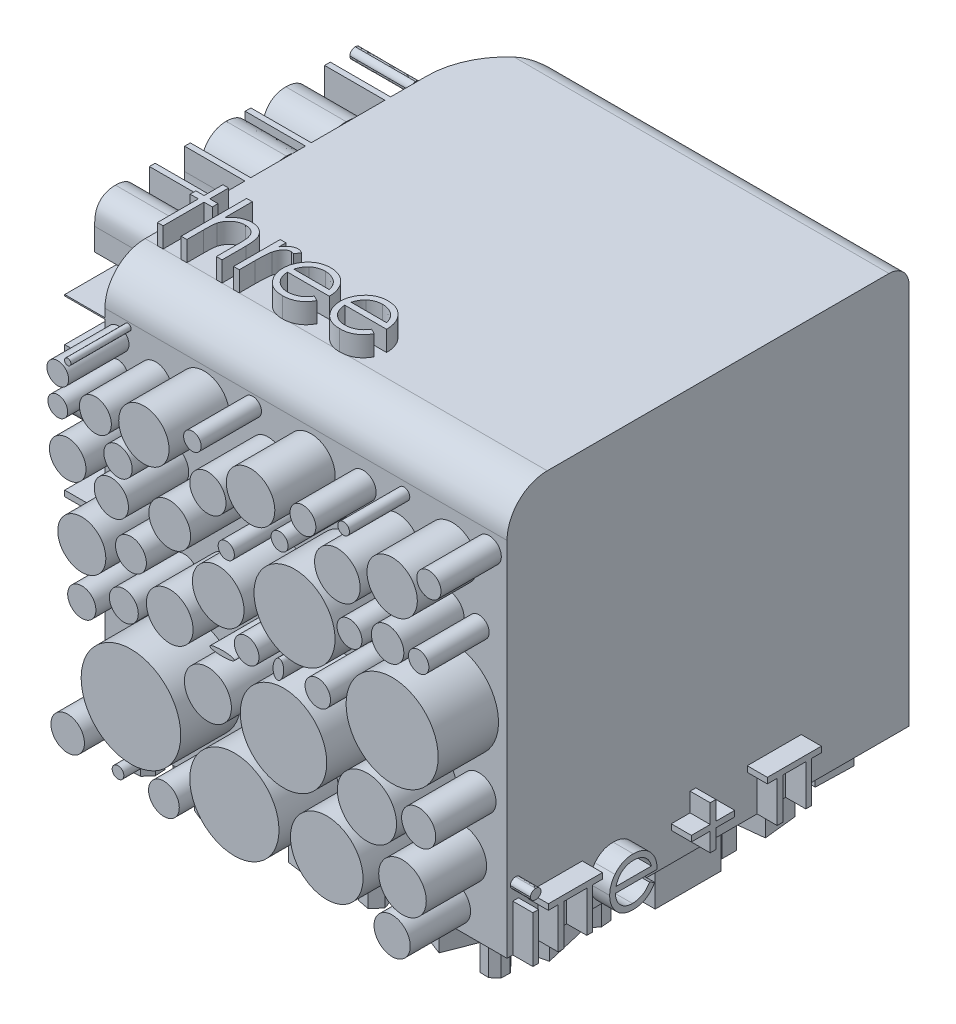
from build123d import *
from OCP.BRepFilletAPI import BRepFilletAPI_MakeFillet

# Parameters (mm, degrees)
SKETCH2_W           = 20
SKETCH2_H           = 20
BOSS_EXTRUDE1_DEPTH = 20
SKETCH3_W           = 0.284935898
SKETCH3_H           = 2.320192308
BOSS_EXTRUDE2_DEPTH = 1
FILLET1_R1          = 2
FILLET1_R2          = 1
FILLET1_R3          = 4
BOSS_EXTRUDE3_DEPTH = 1
SKETCH5_R           = 0.869274054
SKETCH5_R_2         = 1.87334708
SKETCH5_R_3         = 1.224259222
SKETCH5_R_4         = 0.854359486
SKETCH5_R_5         = 0.723058737
SKETCH5_R_6         = 0.828150602
SKETCH5_R_7         = 1.20534194
SKETCH5_R_8         = 2.196982283
SKETCH5_R_9         = 1.648859169
SKETCH5_R_10        = 0.887298728
SKETCH5_R_11        = 1.198491665
SKETCH5_R_12        = 1.240938395
SKETCH5_R_13        = 1.52286101
SKETCH5_R_14        = 2.08407997
SKETCH5_R_15        = 1.116428312
SKETCH5_R_16        = 0.510356374
SKETCH5_R_17        = 0.928303522
SKETCH5_R_18        = 1.048285303
SKETCH5_R_19        = 1.120954627
SKETCH5_R_20        = 1.035138007
SKETCH5_R_21        = 1.063032749
SKETCH5_R_22        = 0.901829478
SKETCH5_R_23        = 0.83084329
SKETCH5_R_24        = 0.806786337
SKETCH5_R_25        = 0.775997991
SKETCH5_R_26        = 0.848871038
SKETCH5_R_27        = 0.739481873
SKETCH5_R_28        = 1.066466648
SKETCH5_R_29        = 0.843889534
SKETCH5_R_30        = 0.704115082
SKETCH5_R_31        = 0.319725843
SKETCH5_R_32        = 0.681387214
SKETCH5_R_33        = 0.790534868
SKETCH5_R_34        = 0.573713006
SKETCH5_R_35        = 0.533233324
SKETCH5_R_36        = 0.625054899
SKETCH5_R_37        = 0.340042365
SKETCH5_R_38        = 0.519725647
SKETCH5_R_39        = 0.813729973
SKETCH5_R_40        = 0.720290961
SKETCH5_R_41        = 0.811333119
SKETCH5_R_42        = 0.907849135
SKETCH5_R_43        = 0.760866236
SKETCH5_R_44        = 0.443440105
SKETCH5_R_45        = 0.505502597
SKETCH5_R_46        = 0.653372918
SKETCH5_R_47        = 0.821463246
SKETCH5_R_48        = 0.243410693
SKETCH5_R_49        = 0.331818637
SKETCH5_R_50        = 0.58557289
SKETCH5_R_51        = 0.913548579
SKETCH5_R_52        = 0.618089992
SKETCH5_R_53        = 0.33645039
SKETCH5_R_54        = 0.353045631
SKETCH5_R_55        = 0.558214156
SKETCH5_R_56        = 0.708578995
SKETCH5_R_57        = 0.386937988
SKETCH5_R_58        = 0.620695254
SKETCH5_R_59        = 0.450911284
SKETCH5_R_60        = 0.446571325
SKETCH5_R_61        = 0.637073751
SKETCH5_R_62        = 0.354108624
SKETCH5_R_63        = 0.719749999
SKETCH5_RX          = 0.571418379
SKETCH5_RY          = 0.334928494
BOSS_EXTRUDE4_DEPTH = 4
SKETCH6_R           = 0.794272448
SKETCH6_R_2         = 0.85045789
SKETCH6_R_3         = 0.901030327
SKETCH6_R_4         = 1.16174239
SKETCH6_R_5         = 1.038098205
SKETCH6_R_6         = 2.014765062
SKETCH6_R_7         = 2.14961737
SKETCH6_R_8         = 2.477089822
SKETCH6_R_9         = 1.183351901
SKETCH6_R_10        = 2.217815956
SKETCH6_R_11        = 1.803840094
SKETCH6_R_12        = 1.195092222
SKETCH6_R_13        = 0.702366469
SKETCH6_R_14        = 1.252556633
SKETCH6_R_15        = 2.290309651
SKETCH6_R_16        = 1.471259211
SKETCH6_R_17        = 1.284780558
SKETCH6_R_18        = 1.169284811
SKETCH6_R_19        = 0.719100487
SKETCH6_R_20        = 0.910166483
SKETCH6_R_21        = 1.250904183
SKETCH6_R_22        = 0.643183028
SKETCH6_R_23        = 1.207146771
SKETCH6_R_24        = 1.133501294
SKETCH6_R_25        = 0.806547414
SKETCH6_R_26        = 0.403167986
SKETCH6_R_27        = 0.767115422
SKETCH6_R_28        = 0.492725753
SKETCH6_R_29        = 0.157493034
SKETCH6_R_30        = 0.541714877
SKETCH6_R_31        = 0.436948105
SKETCH6_R_32        = 0.614399725
SKETCH6_R_33        = 0.834280538
SKETCH6_R_34        = 0.764414303
SKETCH6_R_35        = 0.289432363
SKETCH6_R_36        = 0.90045624
SKETCH6_R_37        = 0.84902596
SKETCH6_R_38        = 0.633160864
SKETCH6_R_39        = 0.705305254
SKETCH6_R_40        = 0.508480831
SKETCH6_R_41        = 0.621454766
SKETCH6_R_42        = 0.603096786
SKETCH6_R_43        = 0.422088862
SKETCH6_RX          = 0.486141315
SKETCH6_RY          = 0.259275368
SKETCH6_RX_2        = 0.611023877
SKETCH6_RY_2        = 0.128636606
BOSS_EXTRUDE5_DEPTH = 3
SKETCH8_W           = 0.284935897
SKETCH8_H           = 3.256410256
BOSS_EXTRUDE6_DEPTH = 1
BOSS_EXTRUDE7_DEPTH = 3
BOSS_EXTRUDE8_DEPTH = 2
SKETCH12_R          = 1.166294009
SKETCH12_RX         = 1.774596882
SKETCH12_RY         = 0.54395597
SKETCH12_RX_2       = 2.602511411
SKETCH12_RY_2       = 1.068399421
SKETCH12_RX_3       = 4.349843028
SKETCH12_RY_3       = 1.733765217
SKETCH12_W          = 3.767290886
SKETCH12_H          = 1.837702871
SKETCH12_W_2        = 0.36920245
SKETCH12_H_2        = 0.373148797
SKETCH12_W_3        = 0.502617764
SKETCH12_H_3        = 0.761382424
SKETCH12_W_4        = 0.698327092
SKETCH12_H_4        = 0.698327091
SKETCH12_W_5        = 1.427652424
SKETCH12_H_5        = 0.796337911
SKETCH12_W_6        = 1.065867665
SKETCH12_H_6        = 0.983370786
SKETCH12_W_7        = 0.742018816
SKETCH12_H_7        = 0.725436044
SKETCH12_W_8        = 0.61451981
SKETCH12_H_8        = 3.271926017
SKETCH12_W_9        = 0.584353933
SKETCH12_H_9        = 0.736554212
BOSS_EXTRUDE9_DEPTH = 2


with BuildPart() as part:
    # Sketch2 → Boss-Extrude1 (new body)
    with BuildSketch(Plane(origin=(0, 0, 0), x_dir=(1, 0, 0), z_dir=(0, 1, 0))):
        with Locations((10, -10)):
            Rectangle(SKETCH2_W, SKETCH2_H)
    extrude(amount=BOSS_EXTRUDE1_DEPTH)

    # Sketch3 → Boss-Extrude2 (add)
    # profile 1 of 6: a face of its own
    with BuildSketch(Plane(origin=(20, 0, 0), x_dir=(0, 0, -1), z_dir=(1, 0, 0))):
        with BuildLine():
            add(Edge.make_bspline(
                [(-19.573868189, 3.297115385), (-19.556186781, 3.296295189), (-19.521563189, 3.294689089), (-19.47149501, 3.280935463), (-19.425904721, 3.257622177), (-19.385466349, 3.226344181), (-19.350766423, 3.189560043), (-19.326472493, 3.146687593), (-19.310858391, 3.100370114), (-19.308972844, 3.06806214), (-19.308012821, 3.05161258)],
                knots=[0, 0, 0, 0, 1.055194115, 2.066272739, 3.074728998, 4.095836921, 5.109056067, 6.073838105, 7.019297344, 8, 8, 8, 8], degree=3))
            add(Edge.make_bspline(
                [(-19.308012821, 3.05161258), (-19.308994494, 3.03559003), (-19.310935147, 3.003915346), (-19.326460432, 2.958400839), (-19.350973462, 2.916124096), (-19.385444098, 2.879411381), (-19.425910617, 2.848150675), (-19.471493444, 2.824832805), (-19.521563601, 2.811080395), (-19.55618692, 2.809474127), (-19.573868189, 2.808653846)],
                knots=[0, 0, 0, 0, 0.96129708, 1.900370562, 2.859976407, 3.87933698, 4.906634145, 5.921202961, 6.938410037, 8, 8, 8, 8], degree=3))
            add(Edge.make_bspline(
                [(-19.573868189, 2.808653846), (-19.591347267, 2.809442807), (-19.625368009, 2.810978415), (-19.674686502, 2.825102646), (-19.71988806, 2.848158655), (-19.760405299, 2.879206694), (-19.794178403, 2.916349565), (-19.818760455, 2.958375039), (-19.834249885, 3.003921915), (-19.836195369, 3.035592237), (-19.837179487, 3.05161258)],
                knots=[0, 0, 0, 0, 1.054934014, 2.053291228, 3.073705704, 4.106921865, 5.123545215, 6.088680038, 7.033164197, 8, 8, 8, 8], degree=3))
            add(Edge.make_bspline(
                [(-19.837179487, 3.05161258), (-19.83621693, 3.068059851), (-19.834326407, 3.100363328), (-19.818748845, 3.146713822), (-19.794383162, 3.189332756), (-19.760382936, 3.226548745), (-19.719894012, 3.257614247), (-19.674684964, 3.280665637), (-19.625368416, 3.294791066), (-19.591347405, 3.296326509), (-19.573868189, 3.297115385)],
                knots=[0, 0, 0, 0, 0.98631895, 1.937192651, 2.907499808, 3.917963147, 4.944918757, 5.95915025, 6.951458133, 8, 8, 8, 8], degree=3))
        make_face()
    # profile 2 of 6: a face of its own
    with BuildSketch(Plane(origin=(20, 0, 0), x_dir=(0, 0, -1), z_dir=(1, 0, 0))):
        with Locations((-19.572596154, 1.160096154)):
            Rectangle(SKETCH3_W, SKETCH3_H)
    # profile 3 of 6: a face of its own
    with BuildSketch(Plane(origin=(20, 0, 0), x_dir=(0, 0, -1), z_dir=(1, 0, 0))):
        Polygon((-16.256585145, 2.03525641), (-16.745046683, 2.03525641), (-16.745046683, 0), (-17.029982581, 0), (-17.029982581, 2.03525641), (-18.169726171, 2.03525641), (-18.169726171, 0), (-18.454662068, 0), (-18.454662068, 2.03525641), (-18.943123606, 2.03525641), (-18.943123606, 2.320192308), (-16.256585145, 2.320192308), align=None)
    # profile 4 of 6: a face of its own
    with BuildSketch(Plane(origin=(20, 0, 0), x_dir=(0, 0, -1), z_dir=(1, 0, 0))):
        with BuildLine():
            Line((-13.909152811, 0.732692308), (-13.656017795, 0.599764623))
            add(Edge.make_bspline(
                [(-13.656017795, 0.599764623), (-13.676189563, 0.563983887), (-13.715435837, 0.494368744), (-13.782927944, 0.398726985), (-13.853677895, 0.312686557), (-13.930879352, 0.238546085), (-14.012222561, 0.1739109), (-14.098158612, 0.117361587), (-14.189134897, 0.069175501), (-14.285155718, 0.028578565), (-14.387027454, -0.002635762), (-14.494996972, -0.024683162), (-14.609271115, -0.038311413), (-14.687599435, -0.039894505), (-14.727707498, -0.040705128)],
                knots=[0, 0, 0, 0, 1.120438281, 2.179929193, 3.190490725, 4.156257408, 5.095198341, 6.022838206, 6.959905092, 7.901321166, 8.864066838, 9.862729781, 10.905609505, 12, 12, 12, 12], degree=3))
            add(Edge.make_bspline(
                [(-14.727707498, -0.040705128), (-14.772286292, -0.039664476), (-14.859246605, -0.037634466), (-14.985829089, -0.020133445), (-15.10500899, 0.008416481), (-15.216779607, 0.048299508), (-15.320867222, 0.100394295), (-15.417478712, 0.163857539), (-15.507122139, 0.238363227), (-15.586972671, 0.324556715), (-15.658858193, 0.416796776), (-15.722290902, 0.5129139), (-15.775320143, 0.612666254), (-15.818457153, 0.7154188), (-15.853295852, 0.820523904), (-15.877577076, 0.928937878), (-15.891574062, 1.040367301), (-15.893718952, 1.115748455), (-15.894799846, 1.153735978)],
                knots=[0, 0, 0, 0, 1.145258523, 2.234067595, 3.276747158, 4.290159414, 5.277019952, 6.260822364, 7.254936242, 8.264827045, 9.274100331, 10.257902744, 11.220704747, 12.172965371, 13.118907548, 14.062713208, 15.023725156, 16, 16, 16, 16], degree=3))
            add(Edge.make_bspline(
                [(-15.894799846, 1.153735978), (-15.893839054, 1.189382002), (-15.89193489, 1.260027716), (-15.879932675, 1.364590031), (-15.858661724, 1.466215842), (-15.829473201, 1.564989591), (-15.791780285, 1.660745898), (-15.745668201, 1.753543042), (-15.691065115, 1.843282276), (-15.648907761, 1.899890833), (-15.627672442, 1.928405449)],
                knots=[0, 0, 0, 0, 1.024358464, 2.0301432, 3.019427413, 4.004406732, 4.986367066, 5.972626655, 6.978780325, 8, 8, 8, 8], degree=3))
            add(Edge.make_bspline(
                [(-15.627672442, 1.928405449), (-15.598909044, 1.962757924), (-15.5422934, 2.030374674), (-15.446538706, 2.119218727), (-15.342852099, 2.193644152), (-15.232532981, 2.25533634), (-15.11429918, 2.302211719), (-14.989740037, 2.337143598), (-14.857437256, 2.356717936), (-14.766990377, 2.359482757), (-14.720711304, 2.360897436)],
                knots=[0, 0, 0, 0, 1.030682036, 2.02871468, 2.997146059, 3.962720338, 4.930598197, 5.918074684, 6.934738563, 8, 8, 8, 8], degree=3))
            add(Edge.make_bspline(
                [(-14.720711304, 2.360897436), (-14.673133834, 2.35966912), (-14.579797682, 2.357259445), (-14.443697115, 2.334919842), (-14.314918465, 2.299493596), (-14.193513265, 2.249461229), (-14.079469206, 2.18490935), (-13.973527575, 2.104952108), (-13.87387656, 2.012044272), (-13.815902349, 1.940594789), (-13.786401409, 1.904236779)],
                knots=[0, 0, 0, 0, 1.056321875, 2.072262726, 3.055038591, 4.01806755, 4.982017516, 5.957941055, 6.960871419, 8, 8, 8, 8], degree=3))
            add(Edge.make_bspline(
                [(-13.786401409, 1.904236779), (-13.766329115, 1.876837816), (-13.726318134, 1.822222265), (-13.676201121, 1.733167001), (-13.632696913, 1.639993819), (-13.597923441, 1.541196621), (-13.56976618, 1.437946002), (-13.549394637, 1.329503836), (-13.537447911, 1.215902417), (-13.535099593, 1.138499042), (-13.53390241, 1.099038462)],
                knots=[0, 0, 0, 0, 0.94817472, 1.890038105, 2.849395472, 3.817997239, 4.812318967, 5.836947057, 6.897266129, 8, 8, 8, 8], degree=3))
            Line((-13.53390241, 1.099038462), (-15.609863949, 1.099038462))
            add(Edge.make_bspline(
                [(-15.609863949, 1.099038462), (-15.608467306, 1.068467326), (-15.605720864, 1.008350421), (-15.592916412, 0.920384068), (-15.572733596, 0.836588251), (-15.544368089, 0.757591491), (-15.510017451, 0.682362018), (-15.467938979, 0.611457885), (-15.417738098, 0.545202048), (-15.361744071, 0.483001859), (-15.29941692, 0.427611026), (-15.233846142, 0.378034057), (-15.164092694, 0.336481837), (-15.090706576, 0.302754366), (-15.013806456, 0.276350779), (-14.933368108, 0.258327828), (-14.849549816, 0.246256381), (-14.792412758, 0.244914113), (-14.763324485, 0.244230769)],
                knots=[0, 0, 0, 0, 1.094153842, 2.151609401, 3.174256925, 4.172055639, 5.149267565, 6.128595816, 7.11444997, 8.118368179, 9.117203808, 10.09244225, 11.054858984, 12.015122123, 12.976791628, 13.957293641, 14.960065497, 16, 16, 16, 16], degree=3))
            add(Edge.make_bspline(
                [(-14.763324485, 0.244230769), (-14.734884516, 0.244782363), (-14.678454161, 0.245876832), (-14.594415669, 0.256519351), (-14.511739097, 0.273728102), (-14.430766634, 0.297214021), (-14.353141652, 0.325858737), (-14.281254617, 0.360423472), (-14.21514185, 0.398659314), (-14.153350031, 0.442392376), (-14.093414201, 0.495921231), (-14.033957803, 0.56271935), (-13.970206839, 0.641720179), (-13.930301994, 0.701179461), (-13.909152811, 0.732692308)],
                knots=[0, 0, 0, 0, 0.99110716, 1.966546729, 2.947904876, 3.932708344, 4.903319531, 5.828989031, 6.710028674, 7.56322171, 8.463672341, 9.504779593, 10.677557249, 12, 12, 12, 12], degree=3))
        make_face()
        with BuildLine():
            add(Edge.make_bspline(
                [(-13.818838308, 1.383974359), (-13.829267388, 1.421768537), (-13.849340012, 1.494510165), (-13.891283, 1.595240115), (-13.938519326, 1.68476414), (-13.994419039, 1.762397092), (-14.057754598, 1.831343136), (-14.130911299, 1.891594282), (-14.212949574, 1.945494398), (-14.303445366, 1.990989879), (-14.399277556, 2.02971568), (-14.499613173, 2.055682749), (-14.60199131, 2.073471405), (-14.671237412, 2.075127947), (-14.706082899, 2.075961538)],
                knots=[0, 0, 0, 0, 1.154881502, 2.222775134, 3.210006277, 4.132804581, 5.035138423, 5.962687519, 6.919655026, 7.923214229, 8.944639381, 9.960483929, 10.97369054, 12, 12, 12, 12], degree=3))
            add(Edge.make_bspline(
                [(-14.706082899, 2.075961538), (-14.734521318, 2.075406665), (-14.790738094, 2.074309797), (-14.873561206, 2.063904751), (-14.953099219, 2.046705463), (-15.029939015, 2.023151538), (-15.10307366, 1.991756592), (-15.174007485, 1.954941807), (-15.240936845, 1.910000514), (-15.282793592, 1.875747838), (-15.303939469, 1.85844351)],
                knots=[0, 0, 0, 0, 1.04873581, 2.073130211, 3.073294108, 4.04793562, 5.032784715, 6.005352987, 6.992311501, 8, 8, 8, 8], degree=3))
            add(Edge.make_bspline(
                [(-15.303939469, 1.85844351), (-15.319082661, 1.844750809), (-15.34972879, 1.81704012), (-15.390677691, 1.769297911), (-15.429884835, 1.717816137), (-15.465566077, 1.660625203), (-15.498293602, 1.598376353), (-15.528918724, 1.531594641), (-15.55648354, 1.459773302), (-15.571992154, 1.409724017), (-15.57997112, 1.383974359)],
                knots=[0, 0, 0, 0, 0.879870761, 1.780643979, 2.707998968, 3.669668524, 4.684282772, 5.740141944, 6.837334558, 8, 8, 8, 8], degree=3))
            Line((-15.57997112, 1.383974359), (-13.818838308, 1.383974359))
        make_face(mode=Mode.SUBTRACT)
    # profile 5 of 6: a face of its own
    with BuildSketch(Plane(origin=(20, 0, 0), x_dir=(0, 0, -1), z_dir=(1, 0, 0))):
        Polygon((-10.894403598, 1.709615385), (-10.894403598, 2.645833333), (-10.6094677, 2.645833333), (-10.6094677, 1.709615385), (-9.673249751, 1.709615385), (-9.673249751, 1.424679487), (-10.6094677, 1.424679487), (-10.6094677, 0.488461538), (-10.894403598, 0.488461538), (-10.894403598, 1.424679487), (-11.830621546, 1.424679487), (-11.830621546, 1.709615385), align=None)
    # profile 6 of 6: a face of its own
    with BuildSketch(Plane(origin=(20, 0, 0), x_dir=(0, 0, -1), z_dir=(1, 0, 0))):
        Polygon((-5.364587302, 2.03525641), (-5.85304884, 2.03525641), (-5.85304884, 0), (-6.137984738, 0), (-6.137984738, 2.03525641), (-7.277728327, 2.03525641), (-7.277728327, 0), (-7.562664225, 0), (-7.562664225, 2.03525641), (-8.051125763, 2.03525641), (-8.051125763, 2.320192308), (-5.364587302, 2.320192308), align=None)
    extrude(amount=BOSS_EXTRUDE2_DEPTH)

    # Fillet1: one fillet with a radius per group of edges: ONE call of the kernel's fillet builder (fillet() takes one radius for all edges)
    fillet1_edges_1 = [part.edges().sort_by_distance(p)[0] for p in [
        (10, 20, 20),
    ]]
    fillet1_edges_2 = [part.edges().sort_by_distance(p)[0] for p in [
        (10, 20, 0),
    ]]
    fillet1_edges_3 = [part.edges().sort_by_distance(p)[0] for p in [
        (0, 10, 0),
    ]]
    fillet1 = BRepFilletAPI_MakeFillet(part.part.solid().wrapped)
    for e in fillet1_edges_1:
        fillet1.Add(FILLET1_R1, e.wrapped)
    for e in fillet1_edges_2:
        fillet1.Add(FILLET1_R2, e.wrapped)
    for e in fillet1_edges_3:
        fillet1.Add(FILLET1_R3, e.wrapped)
    add(Compound.cast(fillet1.Shape()), mode=Mode.REPLACE)

    # Sketch4 → Boss-Extrude3 (add)
    # profile 1 of 5: a face of its own
    with BuildSketch(Plane(origin=(0, 20, 0), x_dir=(1, 0, 0), z_dir=(0, 1, 0))):
        Polygon((0.610576923, -14.743589744), (0.895512821, -14.743589744), (0.895512821, -15.679807692), (1.302564103, -15.679807692), (1.302564103, -15.96474359), (0.895512821, -15.96474359), (0.895512821, -18), (0.610576923, -18), (0.610576923, -15.96474359), (0.203525641, -15.96474359), (0.203525641, -15.679807692), (0.610576923, -15.679807692), align=None)
    # profile 2 of 5: a face of its own
    with BuildSketch(Plane(origin=(0, 20, 0), x_dir=(1, 0, 0), z_dir=(0, 1, 0))):
        with BuildLine():
            Line((1.791025641, -14.743589744), (2.075961538, -14.743589744))
            Line((2.075961538, -14.743589744), (2.075961538, -16.118023838))
            add(Edge.make_bspline(
                [(2.075961538, -16.118023838), (2.106547948, -16.079793226), (2.166101254, -16.005356265), (2.266337017, -15.90823647), (2.369271308, -15.824054864), (2.478459386, -15.757043806), (2.591898072, -15.704106085), (2.710065807, -15.666561577), (2.832984545, -15.643473796), (2.916464502, -15.640572374), (2.958754006, -15.639102564)],
                knots=[0, 0, 0, 0, 1.125788106, 2.19196713, 3.20547328, 4.180437432, 5.132270164, 6.079753143, 7.027236121, 8, 8, 8, 8], degree=3))
            add(Edge.make_bspline(
                [(2.958754006, -15.639102564), (3.001689434, -15.640685919), (3.085724423, -15.643784926), (3.208081178, -15.668289921), (3.322345686, -15.710161311), (3.428178272, -15.767462827), (3.523269248, -15.83883032), (3.607497248, -15.921227487), (3.676295687, -16.01672597), (3.723103457, -16.104951286), (3.753559334, -16.183454299), (3.772837777, -16.250797421), (3.789183764, -16.325838013), (3.803425667, -16.408537449), (3.81291763, -16.499292712), (3.82054182, -16.597694357), (3.825963317, -16.703736743), (3.826173416, -16.777142969), (3.826282051, -16.815099159)],
                knots=[0, 0, 0, 0, 1.235656852, 2.418478516, 3.575258207, 4.727955599, 5.870717718, 6.98870536, 8.107142894, 9.245821548, 9.854588956, 10.528768408, 11.260415777, 12.065282286, 12.943670737, 13.886611085, 14.907229059, 16, 16, 16, 16], degree=3))
            Line((3.826282051, -16.815099159), (3.826282051, -18))
            Line((3.826282051, -18), (3.541346154, -18))
            Line((3.541346154, -18), (3.541346154, -16.90859375))
            add(Edge.make_bspline(
                [(3.541346154, -16.90859375), (3.541173522, -16.877004614), (3.540843306, -16.816579973), (3.5397517, -16.730069289), (3.537314919, -16.651604938), (3.53337717, -16.581438389), (3.529235784, -16.519471821), (3.523535918, -16.465795221), (3.516904491, -16.420334868), (3.510945668, -16.392971241), (3.508273237, -16.380699119)],
                knots=[0, 0, 0, 0, 1.430932559, 2.737130458, 3.918967929, 4.986496826, 5.920444988, 6.731744033, 7.431208747, 8, 8, 8, 8], degree=3))
            add(Edge.make_bspline(
                [(3.508273237, -16.380699119), (3.497909815, -16.344690751), (3.477986196, -16.275464874), (3.431678388, -16.181428259), (3.373839856, -16.101250672), (3.303221269, -16.03601414), (3.221071896, -15.984840815), (3.126856071, -15.949400755), (3.021460524, -15.927404607), (2.947209546, -15.925191811), (2.908508614, -15.924038462)],
                knots=[0, 0, 0, 0, 1.090059168, 2.095632401, 3.037101401, 3.955032261, 4.878929692, 5.839099886, 6.873700383, 8, 8, 8, 8], degree=3))
            add(Edge.make_bspline(
                [(2.908508614, -15.924038462), (2.885587134, -15.924470104), (2.840226117, -15.925324313), (2.772962685, -15.93390035), (2.707712748, -15.947914544), (2.643847916, -15.966877947), (2.582721729, -15.992682113), (2.522552463, -16.022554499), (2.465044859, -16.059119844), (2.409177725, -16.100146076), (2.357182534, -16.145566501), (2.308807222, -16.193506239), (2.265683157, -16.244555671), (2.226613792, -16.297895776), (2.192887776, -16.354258189), (2.163448194, -16.413099392), (2.138469384, -16.474496767), (2.126057227, -16.517109858), (2.119846755, -16.53843149)],
                knots=[0, 0, 0, 0, 1.024319606, 2.027102035, 3.025350316, 4.005802111, 5.00026367, 5.987881639, 7.005602596, 8.042517216, 9.083927026, 10.089214625, 11.084353441, 12.06828073, 13.041928858, 14.016821737, 15.00770877, 16, 16, 16, 16], degree=3))
            add(Edge.make_bspline(
                [(2.119846755, -16.53843149), (2.116273132, -16.553871924), (2.108485767, -16.587518531), (2.100035882, -16.643012382), (2.092472309, -16.707497876), (2.086078268, -16.780877207), (2.082156611, -16.863419262), (2.077930921, -16.954560775), (2.076357923, -17.054872651), (2.076097615, -17.124627861), (2.075961538, -17.161092748)],
                knots=[0, 0, 0, 0, 0.607992626, 1.324890765, 2.152360218, 3.099583803, 4.150613268, 5.323148443, 6.60066238, 8, 8, 8, 8], degree=3))
            Line((2.075961538, -17.161092748), (2.075961538, -18))
            Line((2.075961538, -18), (1.791025641, -18))
            Line((1.791025641, -18), (1.791025641, -14.743589744))
        make_face()
    # profile 3 of 5: a face of its own
    with BuildSketch(Plane(origin=(0, 20, 0), x_dir=(1, 0, 0), z_dir=(0, 1, 0))):
        with BuildLine():
            Line((4.396153846, -15.679807692), (4.681089744, -15.679807692))
            Line((4.681089744, -15.679807692), (4.681089744, -16.021349159))
            add(Edge.make_bspline(
                [(4.681089744, -16.021349159), (4.70212526, -15.989548514), (4.742355523, -15.928730029), (4.80922368, -15.848294306), (4.877715988, -15.781696371), (4.948160337, -15.728625322), (5.021074756, -15.688880564), (5.09485899, -15.659767597), (5.170673881, -15.642552461), (5.221620769, -15.64025407), (5.247145433, -15.639102564)],
                knots=[0, 0, 0, 0, 1.2804753, 2.448899062, 3.506932113, 4.484331642, 5.4025378, 6.288909075, 7.142734305, 8, 8, 8, 8], degree=3))
            add(Edge.make_bspline(
                [(5.247145433, -15.639102564), (5.266945029, -15.640182542), (5.307683985, -15.642404666), (5.369353905, -15.658017343), (5.432893323, -15.682943835), (5.473843917, -15.706384608), (5.495192308, -15.718604768)],
                knots=[0, 0, 0, 0, 0.901110191, 1.854092781, 2.881294221, 4, 4, 4, 4], degree=3))
            Line((5.495192308, -15.718604768), (5.338731971, -15.965379607))
            add(Edge.make_bspline(
                [(5.338731971, -15.965379607), (5.325025931, -15.959265223), (5.299009242, -15.947658951), (5.260950457, -15.933922985), (5.225860958, -15.925834976), (5.20350573, -15.924609682), (5.193083934, -15.924038462)],
                knots=[0, 0, 0, 0, 1.180555205, 2.24091978, 3.179933427, 4, 4, 4, 4], degree=3))
            add(Edge.make_bspline(
                [(5.193083934, -15.924038462), (5.170218733, -15.925562495), (5.123580351, -15.928671083), (5.055105126, -15.95310843), (4.988659447, -15.992592041), (4.935889439, -16.036380835), (4.895029681, -16.078606337), (4.865873905, -16.115480245), (4.839128842, -16.156826575), (4.813574428, -16.201938502), (4.790291432, -16.251586291), (4.768561125, -16.305273921), (4.748913442, -16.363063573), (4.737710006, -16.403324859), (4.731971154, -16.423948317)],
                knots=[0, 0, 0, 0, 1.125678352, 2.296057538, 3.5422874, 4.923748041, 5.663163013, 6.437101912, 7.23742474, 8.08941207, 8.991984279, 9.93940061, 10.944477711, 12, 12, 12, 12], degree=3))
            add(Edge.make_bspline(
                [(4.731971154, -16.423948317), (4.727678197, -16.44234261), (4.718169624, -16.483084572), (4.708924443, -16.551436448), (4.699789952, -16.632193624), (4.693352305, -16.725580891), (4.687385081, -16.831365036), (4.684019507, -16.949707215), (4.681204515, -17.080728898), (4.681129161, -17.172327062), (4.681089744, -17.220242388)],
                knots=[0, 0, 0, 0, 0.566838948, 1.255505196, 2.06880316, 3.007127437, 4.065329342, 5.249902469, 6.561414163, 8, 8, 8, 8], degree=3))
            Line((4.681089744, -17.220242388), (4.681089744, -18))
            Line((4.681089744, -18), (4.396153846, -18))
            Line((4.396153846, -18), (4.396153846, -15.679807692))
        make_face()
    # profile 4 of 5: a face of its own
    with BuildSketch(Plane(origin=(0, 20, 0), x_dir=(1, 0, 0), z_dir=(0, 1, 0))):
        with BuildLine():
            Line((7.684364984, -17.267307692), (7.9375, -17.400235377))
            add(Edge.make_bspline(
                [(7.9375, -17.400235377), (7.917328231, -17.436016113), (7.878081958, -17.505631256), (7.810589851, -17.601273015), (7.739839899, -17.687313443), (7.662638443, -17.761453915), (7.581295234, -17.8260891), (7.495359183, -17.882638413), (7.404382898, -17.930824499), (7.308362076, -17.971421435), (7.206490341, -18.002635762), (7.098520822, -18.024683162), (6.98424668, -18.038311413), (6.90591836, -18.039894505), (6.865810296, -18.040705128)],
                knots=[0, 0, 0, 0, 1.120438281, 2.179929193, 3.190490725, 4.156257408, 5.095198341, 6.022838206, 6.959905092, 7.901321166, 8.864066838, 9.862729781, 10.905609505, 12, 12, 12, 12], degree=3))
            add(Edge.make_bspline(
                [(6.865810296, -18.040705128), (6.821231503, -18.039664476), (6.73427119, -18.037634466), (6.607688705, -18.020133445), (6.488508804, -17.991583519), (6.376738188, -17.951700492), (6.272650573, -17.899605705), (6.176039083, -17.836142461), (6.086395656, -17.761636773), (6.006545124, -17.675443285), (5.934659601, -17.583203224), (5.871226893, -17.4870861), (5.818197652, -17.387333746), (5.775060642, -17.2845812), (5.740221943, -17.179476096), (5.715940718, -17.071062122), (5.701943733, -16.959632699), (5.699798843, -16.884251545), (5.698717949, -16.846264022)],
                knots=[0, 0, 0, 0, 1.145258523, 2.234067595, 3.276747158, 4.290159414, 5.277019952, 6.260822364, 7.254936242, 8.264827045, 9.274100331, 10.257902744, 11.220704747, 12.172965371, 13.118907548, 14.062713208, 15.023725156, 16, 16, 16, 16], degree=3))
            add(Edge.make_bspline(
                [(5.698717949, -16.846264022), (5.699678741, -16.810617998), (5.701582905, -16.739972284), (5.713585119, -16.635409969), (5.734856071, -16.533784158), (5.764044593, -16.435010409), (5.80173751, -16.339254102), (5.847849594, -16.246456958), (5.90245268, -16.156717724), (5.944610034, -16.100109167), (5.965845353, -16.071594551)],
                knots=[0, 0, 0, 0, 1.024358464, 2.0301432, 3.019427413, 4.004406732, 4.986367066, 5.972626655, 6.978780325, 8, 8, 8, 8], degree=3))
            add(Edge.make_bspline(
                [(5.965845353, -16.071594551), (5.994608751, -16.037242076), (6.051224395, -15.969625326), (6.146979089, -15.880781273), (6.250665695, -15.806355848), (6.360984813, -15.74466366), (6.479218615, -15.697788281), (6.603777757, -15.662856402), (6.736080539, -15.643282064), (6.826527418, -15.640517243), (6.87280649, -15.639102564)],
                knots=[0, 0, 0, 0, 1.030682036, 2.02871468, 2.997146059, 3.962720338, 4.930598197, 5.918074684, 6.934738563, 8, 8, 8, 8], degree=3))
            add(Edge.make_bspline(
                [(6.87280649, -15.639102564), (6.920383961, -15.64033088), (7.013720113, -15.642740555), (7.14982068, -15.665080158), (7.27859933, -15.700506404), (7.40000453, -15.750538771), (7.514048589, -15.81509065), (7.61999022, -15.895047892), (7.719641235, -15.987955728), (7.777615446, -16.059405211), (7.807116386, -16.095763221)],
                knots=[0, 0, 0, 0, 1.056321875, 2.072262726, 3.055038591, 4.01806755, 4.982017516, 5.957941055, 6.960871419, 8, 8, 8, 8], degree=3))
            add(Edge.make_bspline(
                [(7.807116386, -16.095763221), (7.82718868, -16.123162184), (7.867199661, -16.177777735), (7.917316673, -16.266832999), (7.960820882, -16.360006181), (7.995594353, -16.458803379), (8.023751615, -16.562053998), (8.044123158, -16.670496164), (8.056069883, -16.784097583), (8.058418202, -16.861500958), (8.059615385, -16.900961538)],
                knots=[0, 0, 0, 0, 0.94817472, 1.890038105, 2.849395472, 3.817997239, 4.812318967, 5.836947057, 6.897266129, 8, 8, 8, 8], degree=3))
            Line((8.059615385, -16.900961538), (5.983653846, -16.900961538))
            add(Edge.make_bspline(
                [(5.983653846, -16.900961538), (5.985050489, -16.931532674), (5.987796931, -16.991649579), (6.000601383, -17.079615932), (6.020784199, -17.163411749), (6.049149706, -17.242408509), (6.083500344, -17.317637982), (6.125578815, -17.388542115), (6.175779696, -17.454797952), (6.231773724, -17.516998141), (6.294100875, -17.572388974), (6.359671652, -17.621965943), (6.429425101, -17.663518163), (6.502811219, -17.697245634), (6.579711339, -17.723649221), (6.660149687, -17.741672172), (6.743967978, -17.753743619), (6.801105037, -17.755085887), (6.830193309, -17.755769231)],
                knots=[0, 0, 0, 0, 1.094153842, 2.151609401, 3.174256925, 4.172055639, 5.149267565, 6.128595816, 7.11444997, 8.118368179, 9.117203808, 10.09244225, 11.054858984, 12.015122123, 12.976791628, 13.957293641, 14.960065497, 16, 16, 16, 16], degree=3))
            add(Edge.make_bspline(
                [(6.830193309, -17.755769231), (6.858633279, -17.755217637), (6.915063634, -17.754123168), (6.999102126, -17.743480649), (7.081778698, -17.726271898), (7.162751161, -17.702785979), (7.240376143, -17.674141263), (7.312263177, -17.639576528), (7.378375944, -17.601340686), (7.440167764, -17.557607624), (7.500103594, -17.504078769), (7.559559992, -17.43728065), (7.623310956, -17.358279821), (7.663215801, -17.298820539), (7.684364984, -17.267307692)],
                knots=[0, 0, 0, 0, 0.99110716, 1.966546729, 2.947904876, 3.932708344, 4.903319531, 5.828989031, 6.710028674, 7.56322171, 8.463672341, 9.504779593, 10.677557249, 12, 12, 12, 12], degree=3))
        make_face()
        with BuildLine():
            add(Edge.make_bspline(
                [(7.774679487, -16.616025641), (7.764250406, -16.578231463), (7.744177783, -16.505489835), (7.702234795, -16.404759885), (7.654998469, -16.31523586), (7.599098755, -16.237602908), (7.535763197, -16.168656864), (7.462606496, -16.108405718), (7.380568221, -16.054505602), (7.290072429, -16.009010121), (7.194240238, -15.97028432), (7.093904621, -15.944317251), (6.991526485, -15.926528595), (6.922280383, -15.924872053), (6.887434896, -15.924038462)],
                knots=[0, 0, 0, 0, 1.154881502, 2.222775134, 3.210006277, 4.132804581, 5.035138423, 5.962687519, 6.919655026, 7.923214229, 8.944639381, 9.960483929, 10.97369054, 12, 12, 12, 12], degree=3))
            add(Edge.make_bspline(
                [(6.887434896, -15.924038462), (6.858996477, -15.924593335), (6.802779701, -15.925690203), (6.719956589, -15.936095249), (6.640418576, -15.953294537), (6.56357878, -15.976848462), (6.490444135, -16.008243408), (6.419510309, -16.045058193), (6.35258095, -16.089999486), (6.310724203, -16.124252162), (6.289578325, -16.14155649)],
                knots=[0, 0, 0, 0, 1.04873581, 2.073130211, 3.073294108, 4.04793562, 5.032784715, 6.005352987, 6.992311501, 8, 8, 8, 8], degree=3))
            add(Edge.make_bspline(
                [(6.289578325, -16.14155649), (6.274435134, -16.155249191), (6.243789005, -16.18295988), (6.202840103, -16.230702089), (6.16363296, -16.282183863), (6.127951718, -16.339374797), (6.095224193, -16.401623647), (6.064599071, -16.468405359), (6.037034254, -16.540226698), (6.02152564, -16.590275983), (6.013546675, -16.616025641)],
                knots=[0, 0, 0, 0, 0.879870761, 1.780643979, 2.707998968, 3.669668524, 4.684282772, 5.740141944, 6.837334558, 8, 8, 8, 8], degree=3))
            Line((6.013546675, -16.616025641), (7.774679487, -16.616025641))
        make_face(mode=Mode.SUBTRACT)
    # profile 5 of 5: a face of its own
    with BuildSketch(Plane(origin=(0, 20, 0), x_dir=(1, 0, 0), z_dir=(0, 1, 0))):
        with BuildLine():
            Line((10.533723958, -17.267307692), (10.786858974, -17.400235377))
            add(Edge.make_bspline(
                [(10.786858974, -17.400235377), (10.766687206, -17.436016113), (10.727440932, -17.505631256), (10.659948825, -17.601273015), (10.589198874, -17.687313443), (10.511997417, -17.761453915), (10.430654208, -17.8260891), (10.344718157, -17.882638413), (10.253741873, -17.930824499), (10.157721051, -17.971421435), (10.055849315, -18.002635762), (9.947879797, -18.024683162), (9.833605654, -18.038311413), (9.755277334, -18.039894505), (9.715169271, -18.040705128)],
                knots=[0, 0, 0, 0, 1.120438281, 2.179929193, 3.190490725, 4.156257408, 5.095198341, 6.022838206, 6.959905092, 7.901321166, 8.864066838, 9.862729781, 10.905609505, 12, 12, 12, 12], degree=3))
            add(Edge.make_bspline(
                [(9.715169271, -18.040705128), (9.670590477, -18.039664476), (9.583630165, -18.037634466), (9.45704768, -18.020133445), (9.337867779, -17.991583519), (9.226097162, -17.951700492), (9.122009547, -17.899605705), (9.025398058, -17.836142461), (8.93575463, -17.761636773), (8.855904098, -17.675443285), (8.784018576, -17.583203224), (8.720585868, -17.4870861), (8.667556627, -17.387333746), (8.624419616, -17.2845812), (8.589580917, -17.179476096), (8.565299693, -17.071062122), (8.551302707, -16.959632699), (8.549157817, -16.884251545), (8.548076923, -16.846264022)],
                knots=[0, 0, 0, 0, 1.145258523, 2.234067595, 3.276747158, 4.290159414, 5.277019952, 6.260822364, 7.254936242, 8.264827045, 9.274100331, 10.257902744, 11.220704747, 12.172965371, 13.118907548, 14.062713208, 15.023725156, 16, 16, 16, 16], degree=3))
            add(Edge.make_bspline(
                [(8.548076923, -16.846264022), (8.549037716, -16.810617998), (8.550941879, -16.739972284), (8.562944094, -16.635409969), (8.584215045, -16.533784158), (8.613403568, -16.435010409), (8.651096484, -16.339254102), (8.697208568, -16.246456958), (8.751811654, -16.156717724), (8.793969008, -16.100109167), (8.815204327, -16.071594551)],
                knots=[0, 0, 0, 0, 1.024358464, 2.0301432, 3.019427413, 4.004406732, 4.986367066, 5.972626655, 6.978780325, 8, 8, 8, 8], degree=3))
            add(Edge.make_bspline(
                [(8.815204327, -16.071594551), (8.843967725, -16.037242076), (8.900583369, -15.969625326), (8.996338063, -15.880781273), (9.10002467, -15.806355848), (9.210343788, -15.74466366), (9.328577589, -15.697788281), (9.453136732, -15.662856402), (9.585439514, -15.643282064), (9.675886392, -15.640517243), (9.722165465, -15.639102564)],
                knots=[0, 0, 0, 0, 1.030682036, 2.02871468, 2.997146059, 3.962720338, 4.930598197, 5.918074684, 6.934738563, 8, 8, 8, 8], degree=3))
            add(Edge.make_bspline(
                [(9.722165465, -15.639102564), (9.769742935, -15.64033088), (9.863079087, -15.642740555), (9.999179654, -15.665080158), (10.127958304, -15.700506404), (10.249363504, -15.750538771), (10.363407564, -15.81509065), (10.469349194, -15.895047892), (10.569000209, -15.987955728), (10.62697442, -16.059405211), (10.656475361, -16.095763221)],
                knots=[0, 0, 0, 0, 1.056321875, 2.072262726, 3.055038591, 4.01806755, 4.982017516, 5.957941055, 6.960871419, 8, 8, 8, 8], degree=3))
            add(Edge.make_bspline(
                [(10.656475361, -16.095763221), (10.676547655, -16.123162184), (10.716558635, -16.177777735), (10.766675648, -16.266832999), (10.810179856, -16.360006181), (10.844953328, -16.458803379), (10.87311059, -16.562053998), (10.893482132, -16.670496164), (10.905428858, -16.784097583), (10.907777176, -16.861500958), (10.908974359, -16.900961538)],
                knots=[0, 0, 0, 0, 0.94817472, 1.890038105, 2.849395472, 3.817997239, 4.812318967, 5.836947057, 6.897266129, 8, 8, 8, 8], degree=3))
            Line((10.908974359, -16.900961538), (8.833012821, -16.900961538))
            add(Edge.make_bspline(
                [(8.833012821, -16.900961538), (8.834409463, -16.931532674), (8.837155906, -16.991649579), (8.849960357, -17.079615932), (8.870143173, -17.163411749), (8.89850868, -17.242408509), (8.932859318, -17.317637982), (8.97493779, -17.388542115), (9.025138671, -17.454797952), (9.081132698, -17.516998141), (9.143459849, -17.572388974), (9.209030627, -17.621965943), (9.278784075, -17.663518163), (9.352170194, -17.697245634), (9.429070313, -17.723649221), (9.509508661, -17.741672172), (9.593326953, -17.753743619), (9.650464011, -17.755085887), (9.679552284, -17.755769231)],
                knots=[0, 0, 0, 0, 1.094153842, 2.151609401, 3.174256925, 4.172055639, 5.149267565, 6.128595816, 7.11444997, 8.118368179, 9.117203808, 10.09244225, 11.054858984, 12.015122123, 12.976791628, 13.957293641, 14.960065497, 16, 16, 16, 16], degree=3))
            add(Edge.make_bspline(
                [(9.679552284, -17.755769231), (9.707992253, -17.755217637), (9.764422609, -17.754123168), (9.848461101, -17.743480649), (9.931137672, -17.726271898), (10.012110135, -17.702785979), (10.089735117, -17.674141263), (10.161622152, -17.639576528), (10.227734919, -17.601340686), (10.289526738, -17.557607624), (10.349462568, -17.504078769), (10.408918966, -17.43728065), (10.472669931, -17.358279821), (10.512574775, -17.298820539), (10.533723958, -17.267307692)],
                knots=[0, 0, 0, 0, 0.99110716, 1.966546729, 2.947904876, 3.932708344, 4.903319531, 5.828989031, 6.710028674, 7.56322171, 8.463672341, 9.504779593, 10.677557249, 12, 12, 12, 12], degree=3))
        make_face()
        with BuildLine():
            add(Edge.make_bspline(
                [(10.624038462, -16.616025641), (10.613609381, -16.578231463), (10.593536757, -16.505489835), (10.551593769, -16.404759885), (10.504357443, -16.31523586), (10.44845773, -16.237602908), (10.385122172, -16.168656864), (10.31196547, -16.108405718), (10.229927195, -16.054505602), (10.139431403, -16.009010121), (10.043599213, -15.97028432), (9.943263596, -15.944317251), (9.84088546, -15.926528595), (9.771639357, -15.924872053), (9.73679387, -15.924038462)],
                knots=[0, 0, 0, 0, 1.154881502, 2.222775134, 3.210006277, 4.132804581, 5.035138423, 5.962687519, 6.919655026, 7.923214229, 8.944639381, 9.960483929, 10.97369054, 12, 12, 12, 12], degree=3))
            add(Edge.make_bspline(
                [(9.73679387, -15.924038462), (9.708355451, -15.924593335), (9.652138675, -15.925690203), (9.569315563, -15.936095249), (9.489777551, -15.953294537), (9.412937754, -15.976848462), (9.339803109, -16.008243408), (9.268869284, -16.045058193), (9.201939924, -16.089999486), (9.160083178, -16.124252162), (9.1389373, -16.14155649)],
                knots=[0, 0, 0, 0, 1.04873581, 2.073130211, 3.073294108, 4.04793562, 5.032784715, 6.005352987, 6.992311501, 8, 8, 8, 8], degree=3))
            add(Edge.make_bspline(
                [(9.1389373, -16.14155649), (9.123794108, -16.155249191), (9.093147979, -16.18295988), (9.052199078, -16.230702089), (9.012991935, -16.282183863), (8.977310692, -16.339374797), (8.944583168, -16.401623647), (8.913958045, -16.468405359), (8.886393229, -16.540226698), (8.870884615, -16.590275983), (8.862905649, -16.616025641)],
                knots=[0, 0, 0, 0, 0.879870761, 1.780643979, 2.707998968, 3.669668524, 4.684282772, 5.740141944, 6.837334558, 8, 8, 8, 8], degree=3))
            Line((8.862905649, -16.616025641), (10.624038462, -16.616025641))
        make_face(mode=Mode.SUBTRACT)
    extrude(amount=BOSS_EXTRUDE3_DEPTH)

    # Sketch5 → Boss-Extrude4 (add)
    with BuildSketch(Plane.XY.offset(20)):
        with Locations((2.852466063, 15.587306963)):
            Circle(SKETCH5_R)
        with Locations((10.332535753, 15.280289178)):
            Circle(SKETCH5_R_2)
        with Locations((4.387554992, 9.558594078)):
            Circle(SKETCH5_R_3)
        with Locations((7.150715064, 12.46130769)):
            Circle(SKETCH5_R_4)
        with Locations((2.517537569, 13.315667175)):
            Circle(SKETCH5_R_5)
        with Locations((11.89553539, 8.334334857)):
            Circle(SKETCH5_R_6)
        with Locations((5.057411979, 5.958112772)):
            Circle(SKETCH5_R_7)
        with Locations((13.346892196, 3.836898979)):
            Circle(SKETCH5_R_8)
        with Locations((14.798249001, 13.828932372)):
            Circle(SKETCH5_R_9)
        with Locations((9.411482396, 10.7828533)):
            Circle(SKETCH5_R_10)
        with Locations((8.005074549, 8.107237273)):
            Circle(SKETCH5_R_11)
        with Locations((8.239232668, 4.752770832)):
            Circle(SKETCH5_R_12)
        with Locations((2.517537569, 2.664649252)):
            Circle(SKETCH5_R_13)
        with Locations((16.807819963, 9.162485459)):
            Circle(SKETCH5_R_14)
        with Locations((17.282301996, 3.836898979)):
            Circle(SKETCH5_R_15)
        with Locations((17.673051905, 1.639916696)):
            Circle(SKETCH5_R_16)
        with Locations((7.625197096, 1.639916696)):
            Circle(SKETCH5_R_17)
        with Locations((11.89553539, 11.670152028)):
            Circle(SKETCH5_R_18)
        with Locations((17.673051905, 16.64791386)):
            Circle(SKETCH5_R_19)
        with Locations((5.611814213, 16.456581018)):
            Circle(SKETCH5_R_20)
        with Locations((1.401109257, 7.506184255)):
            Circle(SKETCH5_R_21)
        with Locations((1.205734302, 11.246565429)):
            Circle(SKETCH5_R_22)
        with Locations((4.387554992, 13.315667175)):
            Circle(SKETCH5_R_23)
        with Locations((5.057411979, 1.966881557)):
            Circle(SKETCH5_R_24)
        with Locations((9.858053721, 6.990808961)):
            Circle(SKETCH5_R_25)
        with Locations((13.151517241, 10.144718942)):
            Circle(SKETCH5_R_26)
        with Locations((13.598088566, 7.506184255)):
            Circle(SKETCH5_R_27)
        with Locations((9.858053721, 2.134345803)):
            Circle(SKETCH5_R_28)
        with Locations((17.673051905, 13.828932372)):
            Circle(SKETCH5_R_29)
        with Locations((18.175444645, 12.014736365)):
            Circle(SKETCH5_R_30)
        with Locations((14.337570439, 11.670152028)):
            Circle(SKETCH5_R_31)
        with Locations((13.598088566, 17.038663769)):
            Circle(SKETCH5_R_32)
        with Locations((6.732054447, 14.672821906)):
            Circle(SKETCH5_R_33)
        with Locations((5.224876226, 11.670152028)):
            Circle(SKETCH5_R_34)
        with Locations((0.842895101, 17.038663769)):
            Circle(SKETCH5_R_35)
        with Locations((0.842895101, 14.672821906)):
            Circle(SKETCH5_R_36)
        with Locations((2.852466063, 17.571897093)):
            Circle(SKETCH5_R_37)
        with Locations((7.522589315, 17.231854728)):
            Circle(SKETCH5_R_38)
        with Locations((15.523927404, 1.213292446)):
            Circle(SKETCH5_R_39)
        with Locations((11.588517604, 0.878363952)):
            Circle(SKETCH5_R_40)
        with Locations((15.523927404, 6.181398435)):
            Circle(SKETCH5_R_41)
        with Locations((18.175444645, 6.181398435)):
            Circle(SKETCH5_R_42)
        with Locations((19.08329378, 2.469274297)):
            Circle(SKETCH5_R_43)
        with Locations((16.249605807, 12.014736365)):
            Circle(SKETCH5_R_44)
        with Locations((12.314196007, 13.315667175)):
            Circle(SKETCH5_R_45)
        with Locations((9.244018149, 12.46130769)):
            Circle(SKETCH5_R_46)
        with Locations((6.732054447, 10.144718942)):
            Circle(SKETCH5_R_47)
        with Locations((15.188998911, 16.64791386)):
            Circle(SKETCH5_R_41)
        with Locations((11.80869341, 17.459246979)):
            Circle(SKETCH5_R_48)
        with Locations((12.819698604, 15.587306963)):
            Circle(SKETCH5_R_49)
        with Locations((7.522589315, 15.9191256)):
            Circle(SKETCH5_R_50)
        with Locations((3.159483848, 11.670152028)):
            Circle(SKETCH5_R_51)
        with Locations((1.401109257, 9.558594078)):
            Circle(SKETCH5_R_52)
        with Locations((2.517537569, 10.17668407)):
            Circle(SKETCH5_R_53)
        with Locations((2.517537569, 8.637540721)):
            Circle(SKETCH5_R_54)
        with Locations((0.842895101, 5.511541447)):
            Circle(SKETCH5_R_55)
        with Locations((2.517537569, 5.762737818)):
            Circle(SKETCH5_R)
        with Locations((3.386811623, 7.716487364)):
            Circle(SKETCH5_R_56)
        with Locations((5.224876226, 8.107237273)):
            Circle(SKETCH5_R_57)
        with Locations((5.057411979, 3.836898979)):
            Circle(SKETCH5_R_58)
        with Locations((6.732054447, 6.739612591)):
            Circle(SKETCH5_R_59)
        with Locations((6.281143163, 4.171827473)):
            Circle(SKETCH5_R_59)
        with Locations((10.332535753, 5.511541447)):
            Circle(SKETCH5_R_60)
        with Locations((10.137160799, 4.171827473)):
            Circle(SKETCH5_R_55)
        with Locations((11.588517604, 6.739612591)):
            Circle(SKETCH5_R_61)
        with Locations((9.578946643, 9.162485459)):
            Circle(SKETCH5_R_62)
        with Locations((10.951443853, 9.893522572)):
            Circle(SKETCH5_R_63)
        with Locations((19.08329378, 4.171827473)):
            Ellipse(SKETCH5_RX, SKETCH5_RY)
    extrude(amount=-BOSS_EXTRUDE4_DEPTH)

    # Sketch6 → Boss-Extrude5 (add)
    with BuildSketch(Plane.XY.offset(20)):
        with Locations((2.524530447, 16.161052684)):
            Circle(SKETCH6_R)
        with Locations((3.318802895, 13.009455844)):
            Circle(SKETCH6_R_2)
        with Locations((8.120222795, 15.61434711)):
            Circle(SKETCH6_R_3)
        with Locations((6.22283286, 9.343312582)):
            Circle(SKETCH6_R_4)
        with Locations((6.22283286, 13.298888207)):
            Circle(SKETCH6_R_5)
        with Locations((12.429549085, 12.46275027)):
            Circle(SKETCH6_R_6)
        with Locations((11.882843511, 6.931376225)):
            Circle(SKETCH6_R_7)
        with Locations((4.293283775, 4.487280717)):
            Circle(SKETCH6_R_8)
        with Locations((17.800127373, 3.458187871)):
            Circle(SKETCH6_R_9)
        with Locations((9.438748003, 2.847163994)):
            Circle(SKETCH6_R_10)
        with Locations((14.032460882, 2.847163994)):
            Circle(SKETCH6_R_11)
        with Locations((1.849188267, 10.243768822)):
            Circle(SKETCH6_R_12)
        with Locations((1.849188267, 7.767514162)):
            Circle(SKETCH6_R_13)
        with Locations((17.285580951, 16.161052684)):
            Circle(SKETCH6_R_14)
        with Locations((17.285580951, 9.954336459)):
            Circle(SKETCH6_R_15)
        with Locations((16.033024318, 6.030919985)):
            Circle(SKETCH6_R_16)
        with Locations((8.634769217, 11.438861044)):
            Circle(SKETCH6_R_17)
        with Locations((8.120222795, 6.931376225)):
            Circle(SKETCH6_R_18)
        with Locations((3.939533109, 8.667970402)):
            Circle(SKETCH6_R_19)
        with Locations((1.146821798, 13.58832057)):
            Circle(SKETCH6_R_20)
        with Locations((4.936466803, 16.51480335)):
            Circle(SKETCH6_R_21)
        with Locations((12.847618054, 16.804235713)):
            Circle(SKETCH6_R_22)
        with Locations((10.242726789, 16.51480335)):
            Circle(SKETCH6_R_23)
        with Locations((14.561765107, 15.307656578)):
            Circle(SKETCH6_R_24)
        with Locations((17.060466891, 13.58832057)):
            Circle(SKETCH6_R_25)
        with Locations((9.035580017, 13.58832057)):
            Circle(SKETCH6_R_26)
        with Locations((4.293283775, 11.047747607)):
            Circle(SKETCH6_R_27)
        with Locations((0.654096045, 15.61434711)):
            Circle(SKETCH6_R_28)
        with Locations((1.146821798, 17.765707532)):
            Circle(SKETCH6_R_29)
        with Locations((0.654096045, 17.029349772)):
            Circle(SKETCH6_R_30)
        with Locations((7.349988659, 17.447418741)):
            Circle(SKETCH6_R_31)
        with Locations((10.04977188, 9.793540702)):
            Circle(SKETCH6_R_32)
        with Locations((1.146821798, 1.753752846)):
            Circle(SKETCH6_R_33)
        with Locations((5.933400498, 1.335683877)):
            Circle(SKETCH6_R_34)
        with Locations((3.650100746, 1.335683877)):
            Circle(SKETCH6_R_35)
        with Locations((17.285580951, 1.110569817)):
            Circle(SKETCH6_R_36)
        with Locations((18.604106159, 6.448988954)):
            Circle(SKETCH6_R_37)
        with Locations((13.587278537, 9.729222399)):
            Circle(SKETCH6_R_38)
        with Locations((3.650100746, 14.746050021)):
            Circle(SKETCH6_R_39)
        with Locations((18.604106159, 13.58832057)):
            Circle(SKETCH6_R_40)
        with Locations((15.163076957, 13.079839739)):
            Circle(SKETCH6_R_41)
        with Locations((14.873644594, 17.447418741)):
            Circle(SKETCH6_R_35)
        with Locations((19.11258699, 17.157986378)):
            Circle(SKETCH6_R_42)
        with Locations((11.685868709, 15.307656578)):
            Circle(SKETCH6_R_43)
        with Locations(Location((11.6255703, 9.76138155), (0, 0, 82.874983651))):
            Ellipse(SKETCH6_RX, SKETCH6_RY)
        with Locations((8.827724126, 9.053880219)):
            Ellipse(SKETCH6_RX_2, SKETCH6_RY_2)
    extrude(amount=BOSS_EXTRUDE5_DEPTH)

    # Sketch8 → Boss-Extrude6 (add)
    with BuildSketch(Plane.ZY):
        with BuildLine():
            Line((4.325641026, 2.320192308), (4.610576923, 2.320192308))
            Line((4.610576923, 2.320192308), (4.610576923, 1.901692708))
            add(Edge.make_bspline(
                [(4.610576923, 1.901692708), (4.641000349, 1.939650035), (4.700038069, 2.013307553), (4.798358143, 2.11011836), (4.902265824, 2.189897243), (5.011124784, 2.253491399), (5.1250828, 2.301430838), (5.243445231, 2.33605279), (5.366920714, 2.356812599), (5.450889882, 2.359525165), (5.493369391, 2.360897436)],
                knots=[0, 0, 0, 0, 1.12780773, 2.188550248, 3.19190651, 4.159438251, 5.104880172, 6.052711206, 7.014878035, 8, 8, 8, 8], degree=3))
            add(Edge.make_bspline(
                [(5.493369391, 2.360897436), (5.536305038, 2.359314294), (5.620340455, 2.356215704), (5.742694125, 2.331707706), (5.856969989, 2.289847367), (5.962760586, 2.232504989), (6.058125987, 2.161197688), (6.141877816, 2.078123558), (6.211150191, 1.982568682), (6.257593513, 1.893919819), (6.288187493, 1.815280699), (6.307448257, 1.74792829), (6.323804933, 1.67289111), (6.337985161, 1.590395911), (6.347580113, 1.499864696), (6.355147763, 1.401668575), (6.360571293, 1.295839357), (6.360786473, 1.222645059), (6.360897436, 1.184900841)],
                knots=[0, 0, 0, 0, 1.235846778, 2.418850247, 3.575807741, 4.728682307, 5.871620074, 6.994088408, 8.11269785, 9.256955736, 9.865816715, 10.540099792, 11.271859618, 12.076849838, 12.949306005, 13.892391288, 14.913166135, 16, 16, 16, 16], degree=3))
            Line((6.360897436, 1.184900841), (6.360897436, 0))
            Line((6.360897436, 0), (6.075961538, 0))
            Line((6.075961538, 0), (6.075961538, 1.09140625))
            add(Edge.make_bspline(
                [(6.075961538, 1.09140625), (6.075786271, 1.122995182), (6.075451015, 1.183419433), (6.074393607, 1.269932762), (6.071844711, 1.348388443), (6.068263027, 1.418598912), (6.063020621, 1.48049675), (6.057557234, 1.534208022), (6.050876147, 1.579664536), (6.044922648, 1.607028575), (6.042252604, 1.619300881)],
                knots=[0, 0, 0, 0, 1.430800155, 2.736877192, 3.918605307, 4.986035426, 5.920637409, 6.731861385, 7.431261377, 8, 8, 8, 8], degree=3))
            add(Edge.make_bspline(
                [(6.042252604, 1.619300881), (6.032613729, 1.655324599), (6.014061877, 1.72465911), (5.968220335, 1.818706559), (5.910331757, 1.898714915), (5.839667279, 1.964189512), (5.756909475, 2.015144486), (5.662287995, 2.05049943), (5.556715943, 2.072612189), (5.482462324, 2.074813944), (5.443760016, 2.075961538)],
                knots=[0, 0, 0, 0, 1.084156227, 2.086665306, 3.027808233, 3.945421172, 4.874247719, 5.839848303, 6.874090471, 8, 8, 8, 8], degree=3))
            add(Edge.make_bspline(
                [(5.443760016, 2.075961538), (5.420838617, 2.075529734), (5.375477762, 2.074675205), (5.308213144, 2.066101527), (5.242967644, 2.0520785), (5.179086455, 2.033147664), (5.117847242, 2.007146892), (5.057282492, 1.977638106), (4.999672784, 1.940855085), (4.943789703, 1.899860735), (4.891798799, 1.85443174), (4.843422377, 1.80649422), (4.800298602, 1.755444208), (4.761229161, 1.702104256), (4.727503165, 1.645741803), (4.698063578, 1.586900611), (4.673084769, 1.525503233), (4.660672612, 1.482890141), (4.654462139, 1.46156851)],
                knots=[0, 0, 0, 0, 1.023777757, 2.026029729, 3.023749952, 4.003683103, 4.997618607, 5.993177895, 7.010360494, 8.046726602, 9.087585522, 10.09234134, 11.086953743, 12.070360549, 13.043493632, 14.017870808, 15.008233677, 16, 16, 16, 16], degree=3))
            add(Edge.make_bspline(
                [(4.654462139, 1.46156851), (4.650888315, 1.445915575), (4.643108287, 1.411839956), (4.63470526, 1.355919662), (4.627078388, 1.291231327), (4.620694861, 1.21785044), (4.616789233, 1.135520082), (4.612530745, 1.044591857), (4.610980382, 0.944703193), (4.610715175, 0.875160086), (4.610576923, 0.838907252)],
                knots=[0, 0, 0, 0, 0.615963638, 1.340920617, 2.168419149, 3.115676021, 4.16674242, 5.331190069, 6.6087489, 8, 8, 8, 8], degree=3))
            Line((4.610576923, 0.838907252), (4.610576923, 0))
            Line((4.610576923, 0), (4.325641026, 0))
            Line((4.325641026, 0), (4.325641026, 2.320192308))
        make_face()
        with BuildLine():
            Line((6.971474359, 2.320192308), (7.256410256, 2.320192308))
            Line((7.256410256, 2.320192308), (7.256410256, 1.244050481))
            add(Edge.make_bspline(
                [(7.256410256, 1.244050481), (7.256538984, 1.212461273), (7.256785235, 1.152032597), (7.258455232, 1.065078249), (7.262383245, 0.985778803), (7.267294357, 0.914088448), (7.273610009, 0.850019315), (7.281124201, 0.793795184), (7.289522912, 0.74477846), (7.297744088, 0.715256987), (7.301567508, 0.701527444)],
                knots=[0, 0, 0, 0, 1.388932606, 2.656963016, 3.823490214, 4.879454478, 5.816252168, 6.653371382, 7.373723809, 8, 8, 8, 8], degree=3))
            add(Edge.make_bspline(
                [(7.301567508, 0.701527444), (7.307701114, 0.684270982), (7.319840809, 0.650116817), (7.341860326, 0.600778219), (7.369100317, 0.555080642), (7.398908875, 0.511261947), (7.433289052, 0.470620145), (7.471805858, 0.433223867), (7.513169973, 0.397660155), (7.574633459, 0.355582523), (7.65868865, 0.310483616), (7.769045078, 0.271570981), (7.888701054, 0.24831563), (7.971400478, 0.245617556), (8.013907252, 0.244230769)],
                knots=[0, 0, 0, 0, 0.725840625, 1.436591201, 2.137033971, 2.831655856, 3.53531722, 4.242432219, 4.957935707, 5.694543706, 7.190802206, 8.724350549, 10.316345118, 12, 12, 12, 12], degree=3))
            add(Edge.make_bspline(
                [(8.013907252, 0.244230769), (8.056410076, 0.245647045), (8.138645178, 0.248387276), (8.256986472, 0.270869486), (8.365164541, 0.308430361), (8.462093618, 0.360869942), (8.547334059, 0.425043099), (8.618367353, 0.500343946), (8.676975362, 0.584390176), (8.702565337, 0.647095772), (8.715434696, 0.678630809)],
                knots=[0, 0, 0, 0, 1.157059328, 2.238695713, 3.266970494, 4.264342957, 5.228770407, 6.160125903, 7.074715775, 8, 8, 8, 8], degree=3))
            add(Edge.make_bspline(
                [(8.715434696, 0.678630809), (8.719239461, 0.691300237), (8.727650869, 0.719309249), (8.736688145, 0.766825163), (8.744829264, 0.823489483), (8.75178086, 0.889673001), (8.756738543, 0.965202761), (8.75941101, 1.050055158), (8.762430231, 1.143963821), (8.762476056, 1.209702431), (8.7625, 1.244050481)],
                knots=[0, 0, 0, 0, 0.557542046, 1.232589297, 2.036731608, 2.971723315, 4.038036528, 5.22795436, 6.551621927, 8, 8, 8, 8], degree=3))
            Line((8.7625, 1.244050481), (8.7625, 2.320192308))
            Line((8.7625, 2.320192308), (9.047435897, 2.320192308))
            Line((9.047435897, 2.320192308), (9.047435897, 1.190625))
            add(Edge.make_bspline(
                [(9.047435897, 1.190625), (9.047035217, 1.152246352), (9.046257843, 1.077786524), (9.041261895, 0.969578794), (9.032689747, 0.868738758), (9.019678882, 0.775213037), (9.004379306, 0.689073036), (8.984643259, 0.610208352), (8.961077286, 0.538861971), (8.934492997, 0.473781931), (8.903086017, 0.414775105), (8.869678649, 0.3587719), (8.831102606, 0.307161881), (8.790489607, 0.257375942), (8.745312391, 0.211890413), (8.696417519, 0.169661575), (8.644493188, 0.130043896), (8.58838713, 0.094582521), (8.528918416, 0.062635993), (8.466013631, 0.03431855), (8.398902297, 0.011909784), (8.328450283, -0.007422034), (8.254312419, -0.022584446), (8.176560177, -0.033276545), (8.095219747, -0.039830953), (8.039784737, -0.040408843), (8.011363181, -0.040705128)],
                knots=[0, 0, 0, 0, 1.493040784, 2.896703357, 4.213163133, 5.428574705, 6.569057535, 7.615249723, 8.588095153, 9.490268104, 10.346124644, 11.18633936, 12.024365274, 12.850166724, 13.684164916, 14.514361689, 15.362232829, 16.222528818, 17.093394965, 17.986930858, 18.902426812, 19.842810585, 20.827885679, 21.843828298, 22.894529745, 24, 24, 24, 24], degree=3))
            add(Edge.make_bspline(
                [(8.011363181, -0.040705128), (7.9831542, -0.040396965), (7.927720927, -0.039791396), (7.846376299, -0.033312757), (7.768408634, -0.022601059), (7.69409513, -0.007310969), (7.623361212, 0.011774473), (7.555920366, 0.034456252), (7.492562277, 0.062650689), (7.432525745, 0.09438033), (7.376280721, 0.130271687), (7.32356794, 0.169612694), (7.274458081, 0.212344623), (7.228940312, 0.258289011), (7.18765354, 0.308015804), (7.150083274, 0.36112499), (7.11565112, 0.417090342), (7.084488231, 0.477019068), (7.057716853, 0.542852249), (7.034081023, 0.615693187), (7.01474923, 0.69634047), (6.999017133, 0.784725148), (6.986361184, 0.880424221), (6.977574469, 0.983991284), (6.972661537, 1.095174061), (6.971878617, 1.171963605), (6.971474359, 1.211613582)],
                knots=[0, 0, 0, 0, 1.083640291, 2.129454052, 3.13281866, 4.105697902, 5.042300162, 5.946461698, 6.836384745, 7.703652036, 8.553297018, 9.397182691, 10.228592656, 11.052265423, 11.879314572, 12.708807002, 13.549817954, 14.402308542, 15.300838682, 16.27712199, 17.341985831, 18.484375296, 19.725102775, 21.0496083, 22.476576903, 24, 24, 24, 24], degree=3))
            Line((6.971474359, 1.211613582), (6.971474359, 2.320192308))
        make_face()
        with Locations((9.80048077, 1.628205128)):
            Rectangle(SKETCH8_W, SKETCH8_H)
        with Locations((10.69599359, 1.628205128)):
            Rectangle(SKETCH8_W, SKETCH8_H)
    extrude(amount=BOSS_EXTRUDE6_DEPTH)

    # Sketch10 → Boss-Extrude7 (add)
    # profile 1 of 6: a face of its own
    with BuildSketch(Plane.ZY):
        with BuildLine():
            add(Edge.make_bspline(
                [(4.549519231, 19.511538462), (4.531826587, 19.512554367), (4.497346143, 19.514534221), (4.447417417, 19.529085166), (4.401791574, 19.5536368), (4.361401677, 19.587370996), (4.327832497, 19.627645037), (4.302998362, 19.673154978), (4.287780441, 19.723228454), (4.285899373, 19.758206286), (4.284935897, 19.776121795)],
                knots=[0, 0, 0, 0, 1.020591893, 1.988988293, 2.974634352, 3.991697318, 5.008760285, 5.983632262, 6.967224335, 8, 8, 8, 8], degree=3))
            add(Edge.make_bspline(
                [(4.284935897, 19.776121795), (4.2859345, 19.793609525), (4.287907128, 19.828154605), (4.303005494, 19.877805615), (4.327801011, 19.923367223), (4.361614239, 19.96354596), (4.401547521, 19.998092046), (4.447562057, 20.022303025), (4.497217413, 20.037920272), (4.531803385, 20.039761833), (4.549519231, 20.040705128)],
                knots=[0, 0, 0, 0, 1.010056097, 1.99525427, 2.971718109, 3.990441831, 5.01702829, 6.004283803, 6.977741589, 8, 8, 8, 8], degree=3))
            add(Edge.make_bspline(
                [(4.549519231, 20.040705128), (4.567222327, 20.039726301), (4.601986724, 20.037804131), (4.651827899, 20.022613512), (4.697563674, 19.997855798), (4.737507336, 19.963608306), (4.771048757, 19.92315799), (4.796995412, 19.878115816), (4.810889134, 19.828011012), (4.813021324, 19.793581241), (4.814102564, 19.776121795)],
                knots=[0, 0, 0, 0, 1.021821805, 2.006599202, 2.982645994, 4.008793999, 5.027082625, 6.009034913, 6.990375297, 8, 8, 8, 8], degree=3))
            add(Edge.make_bspline(
                [(4.814102564, 19.776121795), (4.813053532, 19.758235571), (4.811008912, 19.723374365), (4.797001732, 19.672845064), (4.771017213, 19.627854489), (4.737719195, 19.587309138), (4.697322087, 19.553869332), (4.651969789, 19.528778975), (4.601860008, 19.514648707), (4.567199638, 19.512589084), (4.549519231, 19.511538462)],
                knots=[0, 0, 0, 0, 1.032329927, 2.012066096, 2.992413168, 4.009037178, 5.025661188, 6.000112418, 6.979848586, 8, 8, 8, 8], degree=3))
        make_face()
    # profile 2 of 6: a face of its own
    with BuildSketch(Plane.ZY):
        with BuildLine():
            Line((5.261858974, 16.762670272), (5.261858974, 17.059054487))
            add(Edge.make_bspline(
                [(5.261858974, 17.059054487), (5.288836296, 17.048213339), (5.340039812, 17.027636614), (5.415550724, 17.005262275), (5.484973309, 16.990806282), (5.529562909, 16.988777961), (5.550610978, 16.987820513)],
                knots=[0, 0, 0, 0, 1.16548392, 2.212112691, 3.15604595, 4, 4, 4, 4], degree=3))
            add(Edge.make_bspline(
                [(5.550610978, 16.987820513), (5.565048412, 16.988375207), (5.592587303, 16.989433266), (5.632259851, 16.995621571), (5.667893126, 17.006953725), (5.699321409, 17.022925811), (5.725480447, 17.042070887), (5.747964268, 17.061558522), (5.764227963, 17.083497196), (5.773187098, 17.103911749), (5.778322114, 17.122896052), (5.781231095, 17.142088035), (5.783743471, 17.166282483), (5.785345682, 17.19537276), (5.787479434, 17.229060351), (5.788627832, 17.267661026), (5.789262371, 17.311127082), (5.789167376, 17.341870032), (5.789117588, 17.357982772)],
                knots=[0, 0, 0, 0, 1.331338734, 2.53948105, 3.689136299, 4.764273871, 5.773054392, 6.672324186, 7.497148657, 8.267121549, 8.712809866, 9.307239488, 10.054042404, 10.955009736, 11.992538323, 13.165873169, 14.514600855, 16, 16, 16, 16], degree=3))
            Line((5.789117588, 17.357982772), (5.789117588, 17.679807692))
            Line((5.789117588, 17.679807692), (5.302564103, 17.679807692))
            Line((5.302564103, 17.679807692), (5.302564103, 17.96474359))
            Line((5.302564103, 17.96474359), (5.789753606, 17.96474359))
            Line((5.789753606, 17.96474359), (5.791025641, 20))
            Line((5.791025641, 20), (6.075961538, 20))
            Line((6.075961538, 20), (6.075961538, 17.96474359))
            Line((6.075961538, 17.96474359), (6.401602564, 17.96474359))
            Line((6.401602564, 17.96474359), (6.401602564, 17.679807692))
            Line((6.401602564, 17.679807692), (6.075961538, 17.679807692))
            Line((6.075961538, 17.679807692), (6.075961538, 17.309009415))
            add(Edge.make_bspline(
                [(6.075961538, 17.309009415), (6.075833898, 17.288444259), (6.075589084, 17.24900033), (6.073887266, 17.191923786), (6.069992363, 17.139544896), (6.065018476, 17.091584452), (6.058629032, 17.048308816), (6.051463867, 17.009494572), (6.041622142, 16.975393397), (6.027749258, 16.936118972), (6.004774159, 16.8921711), (5.969344293, 16.845070781), (5.92538937, 16.803706379), (5.874704077, 16.767063307), (5.816405272, 16.738938911), (5.752674301, 16.717306842), (5.682689309, 16.70561523), (5.634180598, 16.703814657), (5.609124599, 16.702884615)],
                knots=[0, 0, 0, 0, 1.116345288, 2.14114814, 3.098813152, 3.966817096, 4.757784664, 5.473233334, 6.10711986, 6.682294791, 7.732310636, 8.784153748, 9.86671089, 10.99714404, 12.165429041, 13.36635898, 14.639656577, 16, 16, 16, 16], degree=3))
            add(Edge.make_bspline(
                [(5.609124599, 16.702884615), (5.583642152, 16.703665984), (5.530325122, 16.705300844), (5.446928423, 16.718068855), (5.356289944, 16.735932266), (5.294185448, 16.753517073), (5.261858974, 16.762670272)],
                knots=[0, 0, 0, 0, 0.86485554, 1.80954081, 2.859827752, 4, 4, 4, 4], degree=3))
        make_face()
    # profile 3 of 6: a face of its own
    with BuildSketch(Plane.ZY):
        with BuildLine():
            Line((7.183904247, 19.267307692), (6.930769231, 19.400235377))
            add(Edge.make_bspline(
                [(6.930769231, 19.400235377), (6.950954488, 19.4360047), (6.990227006, 19.50559764), (7.05743981, 19.601263475), (7.128628931, 19.686518562), (7.205209099, 19.76096267), (7.286219637, 19.826344613), (7.37286696, 19.8823673), (7.463709309, 19.931008171), (7.560064326, 19.970653133), (7.661840076, 20.001858042), (7.769663556, 20.024893049), (7.884033718, 20.03825355), (7.962354653, 20.03987491), (8.002458934, 20.040705128)],
                knots=[0, 0, 0, 0, 1.120547187, 2.180141081, 3.186367408, 4.148075574, 5.090720713, 6.023293347, 6.960451315, 7.899733127, 8.862572377, 9.862522039, 10.90550313, 12, 12, 12, 12], degree=3))
            add(Edge.make_bspline(
                [(8.002458934, 20.040705128), (8.047037728, 20.039664476), (8.13399804, 20.037634466), (8.260580528, 20.020133446), (8.379760416, 19.991583515), (8.491531081, 19.951700508), (8.59561852, 19.89960565), (8.692230662, 19.836142669), (8.781871619, 19.761635981), (8.861731532, 19.67544629), (8.933582249, 19.583192142), (8.997140759, 19.487125936), (9.049662242, 19.387288181), (9.094491406, 19.285194676), (9.127661007, 19.179486653), (9.152425195, 19.071095454), (9.166300694, 18.959624148), (9.168462077, 18.884248679), (9.169551282, 18.846264022)],
                knots=[0, 0, 0, 0, 1.145213001, 2.233978795, 3.276616913, 4.289988888, 5.2768102, 6.260573508, 7.254647871, 8.264498533, 9.273731702, 10.25749501, 11.220258744, 12.169609138, 13.119022067, 14.062790212, 15.023763961, 16, 16, 16, 16], degree=3))
            add(Edge.make_bspline(
                [(9.169551282, 18.846264022), (9.16859049, 18.810617998), (9.166686326, 18.739972284), (9.154684111, 18.635409969), (9.13341316, 18.533784158), (9.104224637, 18.435010409), (9.066531721, 18.339254102), (9.020419637, 18.246456958), (8.965816551, 18.156717724), (8.923659197, 18.100109167), (8.902423878, 18.071594551)],
                knots=[0, 0, 0, 0, 1.024358464, 2.0301432, 3.019427413, 4.004406732, 4.986367066, 5.972626655, 6.978780325, 8, 8, 8, 8], degree=3))
            add(Edge.make_bspline(
                [(8.902423878, 18.071594551), (8.873710068, 18.037185118), (8.817284261, 17.969566783), (8.720857914, 17.881528728), (8.617852042, 17.806219699), (8.50723053, 17.744782444), (8.389179713, 17.697527481), (8.264308488, 17.663915651), (8.132271715, 17.643000835), (8.041759063, 17.640421744), (7.99546274, 17.639102564)],
                knots=[0, 0, 0, 0, 1.030811313, 2.025658015, 2.997072178, 3.962767568, 4.930766827, 5.917075773, 6.934604948, 8, 8, 8, 8], degree=3))
            add(Edge.make_bspline(
                [(7.99546274, 17.639102564), (7.947882534, 17.640324728), (7.854541016, 17.642722335), (7.718479102, 17.665148858), (7.589481658, 17.700281354), (7.468613235, 17.751467733), (7.354011427, 17.814916746), (7.248313783, 17.895113327), (7.148618833, 17.987938486), (7.090650695, 18.059399396), (7.061152845, 18.095763221)],
                knots=[0, 0, 0, 0, 1.056389096, 2.072394598, 3.055233004, 4.020130009, 4.981825462, 5.957811105, 6.960805292, 8, 8, 8, 8], degree=3))
            add(Edge.make_bspline(
                [(7.061152845, 18.095763221), (7.041080551, 18.123162184), (7.00106957, 18.177777735), (6.950952557, 18.266832999), (6.907448349, 18.360006181), (6.872674877, 18.458803379), (6.844517616, 18.562053998), (6.824146073, 18.670496164), (6.812199347, 18.784097583), (6.809851029, 18.861500958), (6.808653846, 18.900961538)],
                knots=[0, 0, 0, 0, 0.94817472, 1.890038105, 2.849395472, 3.817997239, 4.812318967, 5.836947057, 6.897266129, 8, 8, 8, 8], degree=3))
            Line((6.808653846, 18.900961538), (8.884615385, 18.900961538))
            add(Edge.make_bspline(
                [(8.884615385, 18.900961538), (8.883217415, 18.931532056), (8.880468365, 18.991647745), (8.867682765, 19.079622886), (8.847431637, 19.163386857), (8.819281982, 19.242582757), (8.783985218, 19.317470616), (8.742106611, 19.38856655), (8.691839004, 19.454790832), (8.635864123, 19.517001647), (8.573528438, 19.572382213), (8.507972302, 19.621988814), (8.438335277, 19.663336057), (8.365319365, 19.697403005), (8.2885459, 19.72362321), (8.208122846, 19.741679334), (8.124300383, 19.753741734), (8.0671639, 19.755085251), (8.038075921, 19.755769231)],
                knots=[0, 0, 0, 0, 1.094405546, 2.152104367, 3.174987145, 4.173015398, 5.153654967, 6.133208507, 7.119289451, 8.123438607, 9.122504012, 10.097966803, 11.060604936, 12.014205423, 12.976096155, 13.956823727, 14.959826266, 16, 16, 16, 16], degree=3))
            add(Edge.make_bspline(
                [(8.038075921, 19.755769231), (8.009633986, 19.755225918), (7.953199729, 19.754147881), (7.868983937, 19.743356941), (7.785938574, 19.726538177), (7.705140488, 19.702134251), (7.627883629, 19.673273013), (7.555736542, 19.639527447), (7.489376701, 19.601491995), (7.427472934, 19.557595385), (7.367755485, 19.504281212), (7.308326194, 19.437624734), (7.24517388, 19.358320461), (7.205096003, 19.298786914), (7.183904247, 19.267307692)],
                knots=[0, 0, 0, 0, 0.991026944, 1.966387566, 2.954903586, 3.941705208, 4.905318989, 5.827751054, 6.715113263, 7.568237245, 8.468614997, 9.499196909, 10.677664282, 12, 12, 12, 12], degree=3))
        make_face()
        with BuildLine():
            add(Edge.make_bspline(
                [(7.093589744, 18.616025641), (7.103958869, 18.57820355), (7.12386422, 18.505597423), (7.166523926, 18.405325801), (7.212339714, 18.315185011), (7.268602764, 18.237454421), (7.33227534, 18.168787191), (7.406048946, 18.10914119), (7.487486334, 18.054430391), (7.578068028, 18.008822107), (7.674293097, 17.971356255), (7.774163714, 17.943803949), (7.876848839, 17.927608633), (7.946009566, 17.925234113), (7.980834335, 17.924038462)],
                knots=[0, 0, 0, 0, 1.154958961, 2.217145986, 3.207012531, 4.129872728, 5.036522214, 5.960144231, 6.920619777, 7.92424629, 8.943461387, 9.961007416, 10.973298156, 12, 12, 12, 12], degree=3))
            add(Edge.make_bspline(
                [(7.980834335, 17.924038462), (8.009274122, 17.924589237), (8.065493603, 17.925678006), (8.148296948, 17.936142254), (8.228167615, 17.953180142), (8.304722709, 17.977557607), (8.37813515, 18.008210793), (8.448741766, 18.045101669), (8.515692702, 18.089988283), (8.557546511, 18.124248402), (8.578690905, 18.14155649)],
                knots=[0, 0, 0, 0, 1.04879286, 2.073242986, 3.073461291, 4.057960153, 5.032623303, 6.005244481, 6.992256684, 8, 8, 8, 8], degree=3))
            add(Edge.make_bspline(
                [(8.578690905, 18.14155649), (8.59383647, 18.155247752), (8.624487402, 18.182955528), (8.665399262, 18.2307202), (8.704863051, 18.282255483), (8.739932378, 18.339810942), (8.773260568, 18.40171753), (8.80363119, 18.468426965), (8.831245565, 18.540220828), (8.846747188, 18.590273988), (8.854722556, 18.616025641)],
                knots=[0, 0, 0, 0, 0.879905587, 1.780714457, 2.708106151, 3.677566983, 4.684151534, 5.740052498, 6.837288539, 8, 8, 8, 8], degree=3))
            Line((8.854722556, 18.616025641), (7.093589744, 18.616025641))
        make_face(mode=Mode.SUBTRACT)
    # profile 4 of 6: a face of its own
    with BuildSketch(Plane.ZY):
        with BuildLine():
            Line((9.739423077, 16.743589744), (9.739423077, 20))
            Line((9.739423077, 20), (10.024358974, 20))
            Line((10.024358974, 20), (10.024358974, 19.598672877))
            add(Edge.make_bspline(
                [(10.024358974, 19.598672877), (10.056532406, 19.634944428), (10.119412634, 19.705834081), (10.223428441, 19.79901684), (10.334596022, 19.875095977), (10.45102143, 19.936849561), (10.573605835, 19.983400581), (10.701629306, 20.016195198), (10.834991674, 20.037528562), (10.925937581, 20.039636773), (10.97202524, 20.040705128)],
                knots=[0, 0, 0, 0, 1.074235403, 2.099501444, 3.086304576, 4.053325556, 5.01427503, 5.985443889, 6.979105517, 8, 8, 8, 8], degree=3))
            add(Edge.make_bspline(
                [(10.97202524, 20.040705128), (11.012999138, 20.039592818), (11.09380148, 20.037399293), (11.21266197, 20.020376549), (11.327051565, 19.993053572), (11.437043168, 19.955007403), (11.541891496, 19.904800873), (11.64218734, 19.844044037), (11.738164775, 19.772400995), (11.827998509, 19.690178804), (11.910827438, 19.600968267), (11.983294384, 19.505540068), (12.044712481, 19.405204913), (12.095187157, 19.299991001), (12.134247108, 19.189975243), (12.161422265, 19.075233113), (12.178426665, 18.955955535), (12.180619079, 18.87473005), (12.181730769, 18.83354367)],
                knots=[0, 0, 0, 0, 1.034036272, 2.039165313, 3.024406509, 3.999331371, 4.971254918, 5.953351348, 6.95522652, 7.989525907, 9.023492927, 10.024309745, 11.009187477, 11.988246066, 12.964946762, 13.950187958, 14.960617622, 16, 16, 16, 16], degree=3))
            add(Edge.make_bspline(
                [(12.181730769, 18.83354367), (12.180594422, 18.793208567), (12.178347925, 18.713468244), (12.161604217, 18.596196481), (12.13346943, 18.483231458), (12.093910591, 18.374991639), (12.043409075, 18.271041107), (11.980934726, 18.172193172), (11.908493892, 18.07693574), (11.824779732, 17.988323547), (11.734139707, 17.906768435), (11.637625289, 17.834951286), (11.536439915, 17.774350226), (11.430380694, 17.725087455), (11.320198619, 17.685940259), (11.205056697, 17.658650893), (11.085478546, 17.642609115), (11.004298738, 17.640282645), (10.963120994, 17.639102564)],
                knots=[0, 0, 0, 0, 1.02050356, 2.017480486, 2.990790918, 3.96161403, 4.928589988, 5.909588639, 6.91611943, 7.952353252, 8.989586576, 9.99823133, 10.991940466, 11.968822692, 12.952985106, 13.945868367, 14.958059758, 16, 16, 16, 16], degree=3))
            add(Edge.make_bspline(
                [(10.963120994, 17.639102564), (10.915745707, 17.640499387), (10.822753284, 17.643241195), (10.686735418, 17.666936414), (10.557608541, 17.704864353), (10.435377613, 17.758739073), (10.321115529, 17.828950685), (10.213294846, 17.913387627), (10.113567615, 18.014172666), (10.054548555, 18.09003225), (10.024358974, 18.128836138)],
                knots=[0, 0, 0, 0, 1.03083325, 2.023411113, 2.996083796, 3.9549903, 4.922369457, 5.908572979, 6.930187902, 8, 8, 8, 8], degree=3))
            Line((10.024358974, 18.128836138), (10.024358974, 16.743589744))
            Line((10.024358974, 16.743589744), (9.739423077, 16.743589744))
        make_face()
        with BuildLine():
            add(Edge.make_bspline(
                [(10.959304888, 17.924038462), (11.00095488, 17.925521657), (11.08316534, 17.928449248), (11.203867857, 17.951267094), (11.319311963, 17.989330458), (11.429309925, 18.041086525), (11.530824898, 18.10738445), (11.623055972, 18.185554844), (11.70350292, 18.276555444), (11.771523078, 18.378295496), (11.827992416, 18.486711882), (11.866960644, 18.600871052), (11.892843518, 18.717687514), (11.895474324, 18.796941696), (11.896794872, 18.836723758)],
                knots=[0, 0, 0, 0, 1.031179624, 2.035384561, 3.030098214, 4.035455833, 5.037557836, 6.024646278, 7.02156144, 8.035264006, 9.049836703, 10.039645228, 11.015989397, 12, 12, 12, 12], degree=3))
            add(Edge.make_bspline(
                [(11.896794872, 18.836723758), (11.895080638, 18.876258356), (11.891658891, 18.955172588), (11.867755804, 19.072168067), (11.825798958, 19.185582438), (11.770564864, 19.295396362), (11.701473981, 19.397895285), (11.621185811, 19.490576163), (11.528486739, 19.569951551), (11.426077864, 19.636436862), (11.316815776, 19.689918954), (11.201872879, 19.727640042), (11.083252593, 19.751456807), (11.00245296, 19.754326921), (10.961848958, 19.755769231)],
                knots=[0, 0, 0, 0, 0.979235476, 1.954632679, 2.943119654, 3.967171814, 4.992637064, 5.997548408, 6.995574264, 8.005058949, 9.015076297, 9.999929117, 10.994910263, 12, 12, 12, 12], degree=3))
            add(Edge.make_bspline(
                [(10.961848958, 19.755769231), (10.920623144, 19.754268658), (10.838837623, 19.751291758), (10.717717752, 19.728316549), (10.600394804, 19.689780556), (10.487824242, 19.637305916), (10.38313339, 19.572250125), (10.289609004, 19.495750334), (10.20881293, 19.408143775), (10.142290679, 19.30995392), (10.089140299, 19.20349581), (10.051505798, 19.089788212), (10.028647927, 18.969506817), (10.025808393, 18.88707082), (10.024358974, 18.844991987)],
                knots=[0, 0, 0, 0, 1.017730373, 2.019016736, 3.032373701, 4.060729657, 5.079187105, 6.068726676, 7.03591854, 8.011858086, 8.988317194, 9.965225429, 10.961364673, 12, 12, 12, 12], degree=3))
            add(Edge.make_bspline(
                [(10.024358974, 18.844991987), (10.025229534, 18.812935539), (10.02694307, 18.749838305), (10.040033461, 18.65719388), (10.060857578, 18.568536075), (10.090197556, 18.483767852), (10.12875296, 18.403371988), (10.175205301, 18.32671829), (10.230507386, 18.254520777), (10.292976231, 18.186870882), (10.362125037, 18.125476048), (10.43565583, 18.071363157), (10.513383608, 18.025568761), (10.59525381, 17.988921266), (10.680635866, 17.959065471), (10.770348147, 17.939346235), (10.863486517, 17.925762724), (10.927029142, 17.924619267), (10.959304888, 17.924038462)],
                knots=[0, 0, 0, 0, 1.050062701, 2.066855696, 3.059271411, 4.030305351, 4.999747758, 5.975466543, 6.961907836, 7.974539719, 8.98812422, 9.98710676, 10.961662635, 11.93785114, 12.922015094, 13.919620009, 14.94329489, 16, 16, 16, 16], degree=3))
        make_face(mode=Mode.SUBTRACT)
    # profile 5 of 6: a face of its own
    with BuildSketch(Plane.ZY):
        with BuildLine():
            Line((14.786858974, 17.679807692), (14.501923077, 17.679807692))
            Line((14.501923077, 17.679807692), (14.501923077, 18.098307292))
            add(Edge.make_bspline(
                [(14.501923077, 18.098307292), (14.471552169, 18.060293209), (14.412708929, 17.986641419), (14.313706409, 17.890600216), (14.210476236, 17.810006283), (14.101341789, 17.746550149), (13.987426085, 17.698558117), (13.869052359, 17.663950206), (13.745579909, 17.643186627), (13.661610327, 17.640474575), (13.619130609, 17.639102564)],
                knots=[0, 0, 0, 0, 1.127869841, 2.185233117, 3.191641716, 4.159226741, 5.10472073, 6.052603964, 7.014823782, 8, 8, 8, 8], degree=3))
            add(Edge.make_bspline(
                [(13.619130609, 17.639102564), (13.576174468, 17.640596271), (13.492056793, 17.64352128), (13.370022741, 17.66929444), (13.255248744, 17.71008063), (13.149269518, 17.76740361), (13.053715771, 17.838573785), (12.970854385, 17.922056931), (12.901172172, 18.016847292), (12.854662528, 18.105573295), (12.824580584, 18.184384709), (12.804811913, 18.251794188), (12.788818636, 18.326926991), (12.774488039, 18.409597358), (12.764927957, 18.500137331), (12.757349815, 18.598330817), (12.75192938, 18.704160812), (12.751713755, 18.777354999), (12.751602564, 18.815099159)],
                knots=[0, 0, 0, 0, 1.235764162, 2.419900973, 3.574701258, 4.732869372, 5.875730734, 6.993815468, 8.107424371, 9.251605764, 9.866123335, 10.534503958, 11.272175692, 12.077112099, 12.949509943, 13.89253218, 14.913238789, 16, 16, 16, 16], degree=3))
            Line((12.751602564, 18.815099159), (12.751602564, 20))
            Line((12.751602564, 20), (13.036538462, 20))
            Line((13.036538462, 20), (13.036538462, 18.90859375))
            add(Edge.make_bspline(
                [(13.036538462, 18.90859375), (13.036713004, 18.877004772), (13.037046873, 18.816580434), (13.038113693, 18.730067695), (13.040624939, 18.65182168), (13.044298784, 18.581617519), (13.049441239, 18.519712161), (13.054946331, 18.465792256), (13.061623197, 18.420335413), (13.067577149, 18.392971409), (13.070247396, 18.380699119)],
                knots=[0, 0, 0, 0, 1.430803381, 2.736883362, 3.918614142, 4.976458302, 5.92063272, 6.731858525, 7.431260095, 8, 8, 8, 8], degree=3))
            add(Edge.make_bspline(
                [(13.070247396, 18.380699119), (13.079838425, 18.344649521), (13.098249095, 18.275449729), (13.14466761, 18.18174609), (13.201924352, 18.101322153), (13.272864142, 18.035831942), (13.355581713, 17.984849498), (13.450214576, 17.949502325), (13.555783328, 17.927387313), (13.630037426, 17.925185885), (13.668739984, 17.924038462)],
                knots=[0, 0, 0, 0, 1.084232, 2.08126119, 3.027460722, 3.945137793, 4.874029258, 5.839697328, 6.874011781, 8, 8, 8, 8], degree=3))
            add(Edge.make_bspline(
                [(13.668739984, 17.924038462), (13.691663501, 17.924463892), (13.737028548, 17.925305807), (13.80426228, 17.933972426), (13.869684599, 17.947660258), (13.933120235, 17.967878124), (13.994697386, 17.992460224), (14.054670873, 18.022623616), (14.112202694, 18.059108797), (14.168101827, 18.100118188), (14.220057707, 18.145787293), (14.269090782, 18.193279986), (14.312172406, 18.244584902), (14.35127848, 18.297888072), (14.384994796, 18.354260245), (14.414436976, 18.413098833), (14.439415092, 18.474496908), (14.451827341, 18.517109905), (14.458037861, 18.53843149)],
                knots=[0, 0, 0, 0, 1.023939463, 2.026349741, 3.024227553, 4.007104963, 4.997624259, 5.984875705, 7.002218968, 8.038748769, 9.079772093, 10.091408226, 11.086177727, 12.069739863, 13.043026652, 14.017557731, 15.008077027, 16, 16, 16, 16], degree=3))
            add(Edge.make_bspline(
                [(14.458037861, 18.53843149), (14.461611685, 18.554084425), (14.469391713, 18.588160044), (14.47779474, 18.644080338), (14.485421612, 18.708768673), (14.491805139, 18.78214956), (14.495710767, 18.864479918), (14.499969255, 18.955408143), (14.501519618, 19.055296807), (14.501784825, 19.124839914), (14.501923077, 19.161092748)],
                knots=[0, 0, 0, 0, 0.615963638, 1.340920617, 2.168419149, 3.115676021, 4.16674242, 5.331190069, 6.6087489, 8, 8, 8, 8], degree=3))
            Line((14.501923077, 19.161092748), (14.501923077, 20))
            Line((14.501923077, 20), (14.786858974, 20))
            Line((14.786858974, 20), (14.786858974, 17.679807692))
        make_face()
    # profile 6 of 6: a face of its own
    with BuildSketch(Plane.ZY):
        with BuildLine():
            Line((17.514102564, 17.679807692), (17.229166667, 17.679807692))
            Line((17.229166667, 17.679807692), (17.229166667, 18.755949519))
            add(Edge.make_bspline(
                [(17.229166667, 18.755949519), (17.229037939, 18.787538727), (17.228791688, 18.847967403), (17.227121692, 18.934921751), (17.223193678, 19.014221197), (17.218282566, 19.085911552), (17.211966914, 19.149980685), (17.204452722, 19.206204816), (17.196054011, 19.25522154), (17.187832835, 19.284743013), (17.184009415, 19.298472556)],
                knots=[0, 0, 0, 0, 1.388932606, 2.656963016, 3.823490214, 4.879454478, 5.816252168, 6.653371382, 7.373723809, 8, 8, 8, 8], degree=3))
            add(Edge.make_bspline(
                [(17.184009415, 19.298472556), (17.177875769, 19.31572897), (17.165735995, 19.34988304), (17.143717062, 19.399222336), (17.116474895, 19.444917315), (17.086674414, 19.488745657), (17.052263709, 19.529350994), (17.013745925, 19.566998531), (16.971804745, 19.602127441), (16.910369221, 19.644495716), (16.826386098, 19.6893331), (16.716370845, 19.728560205), (16.596866097, 19.751659143), (16.514173127, 19.75437388), (16.471669671, 19.755769231)],
                knots=[0, 0, 0, 0, 0.725930277, 1.436768641, 2.137297926, 2.832005607, 3.535753883, 4.242956221, 4.964984144, 5.701683124, 7.198126434, 8.723945959, 10.316137162, 12, 12, 12, 12], degree=3))
            add(Edge.make_bspline(
                [(16.471669671, 19.755769231), (16.42916083, 19.754379092), (16.347122492, 19.751696245), (16.228866393, 19.728908955), (16.120567036, 19.691733369), (16.023488912, 19.639112717), (15.938241439, 19.574961308), (15.867209937, 19.499654919), (15.808601468, 19.415610109), (15.783011555, 19.352904324), (15.770142228, 19.321369191)],
                knots=[0, 0, 0, 0, 1.157091467, 2.233085092, 3.266839029, 4.264239195, 5.228693433, 6.160074799, 7.074690074, 8, 8, 8, 8], degree=3))
            add(Edge.make_bspline(
                [(15.770142228, 19.321369191), (15.766334647, 19.308700032), (15.757917017, 19.280691616), (15.748937648, 19.233170163), (15.74051409, 19.176554224), (15.734898188, 19.110249231), (15.728488717, 19.034839887), (15.726275511, 18.949936218), (15.723114937, 18.856038678), (15.723089969, 18.790298426), (15.723076923, 18.755949519)],
                knots=[0, 0, 0, 0, 0.557560243, 1.232629526, 2.036798082, 2.970922211, 4.03790722, 5.227863888, 6.551574656, 8, 8, 8, 8], degree=3))
            Line((15.723076923, 18.755949519), (15.723076923, 17.679807692))
            Line((15.723076923, 17.679807692), (15.438141026, 17.679807692))
            Line((15.438141026, 17.679807692), (15.438141026, 18.809375))
            add(Edge.make_bspline(
                [(15.438141026, 18.809375), (15.438543145, 18.847753435), (15.439323311, 18.922212849), (15.444299687, 19.03042348), (15.452957046, 19.131462913), (15.46575827, 19.225021849), (15.481287921, 19.311122661), (15.500925306, 19.389792441), (15.524497848, 19.4611406), (15.551097098, 19.526208158), (15.582442967, 19.585259918), (15.616009899, 19.640993122), (15.653752631, 19.693224037), (15.694916511, 19.742430516), (15.740692969, 19.787418474), (15.788691524, 19.830494553), (15.841256062, 19.869001248), (15.896615145, 19.904989796), (15.95616441, 19.936927143), (16.019391667, 19.964561638), (16.086230031, 19.988571347), (16.156783893, 20.007124819), (16.231011882, 20.022777708), (16.308819217, 20.033196025), (16.390353972, 20.039848013), (16.4457911, 20.040414626), (16.474213742, 20.040705128)],
                knots=[0, 0, 0, 0, 1.493120159, 2.896857355, 4.213387119, 5.437035652, 6.569467867, 7.615715674, 8.588612823, 9.490833737, 10.346735778, 11.186995163, 12.020221603, 12.851363391, 13.679553205, 14.515225522, 15.358192885, 16.211587453, 17.082499898, 17.983626775, 18.894104459, 19.842498226, 20.819547185, 21.843713668, 22.894470975, 24, 24, 24, 24], degree=3))
            add(Edge.make_bspline(
                [(16.474213742, 20.040705128), (16.502422873, 20.040397396), (16.557856441, 20.039792675), (16.639198945, 20.033307934), (16.717174233, 20.022618124), (16.791460657, 20.00725029), (16.862357634, 19.988421801), (16.929520964, 19.964730443), (16.993035461, 19.936769016), (17.053037782, 19.904959954), (17.109328857, 19.869132243), (17.161782165, 19.829699838), (17.211332813, 19.787691574), (17.25660534, 19.741674768), (17.2979318, 19.691993945), (17.335491358, 19.638872355), (17.369926429, 19.582910383), (17.401088513, 19.522980725), (17.427860123, 19.457147813), (17.451495884, 19.384306795), (17.470827698, 19.303659536), (17.486559788, 19.215274851), (17.49921574, 19.119575779), (17.508002454, 19.016008716), (17.512915386, 18.904825939), (17.513698306, 18.828036395), (17.514102564, 18.788386418)],
                knots=[0, 0, 0, 0, 1.083759936, 2.129689164, 3.133164553, 4.10615121, 5.04285688, 5.949793092, 6.839814394, 7.707177441, 8.556916231, 9.400895077, 10.227072161, 11.05083587, 11.877976332, 12.707560346, 13.548664154, 14.401248865, 15.299878211, 16.27626931, 17.341250723, 18.483766318, 19.724630785, 21.049282549, 22.476408703, 24, 24, 24, 24], degree=3))
            Line((17.514102564, 18.788386418), (17.514102564, 17.679807692))
        make_face()
    extrude(amount=BOSS_EXTRUDE7_DEPTH)

    # Sketch11 → Boss-Extrude8 (add)
    # profile 1 of 3: a face of its own
    with BuildSketch(Plane.ZY):
        Polygon((20, 15.150641026), (16.825, 15.150641026), (16.825, 15.210426683), (19.323913261, 17.308012821), (16.825, 17.308012821), (16.825, 17.592948718), (20, 17.592948718), (20, 17.52807492), (17.506810897, 15.435576923), (20, 15.435576923), align=None)
    # profile 2 of 3: a face of its own
    with BuildSketch(Plane.ZY):
        with BuildLine():
            Line((17.679807692, 14.417948718), (20, 14.417948718))
            Line((20, 14.417948718), (20, 14.133012821))
            Line((20, 14.133012821), (19.598672877, 14.133012821))
            add(Edge.make_bspline(
                [(19.598672877, 14.133012821), (19.63493466, 14.100832757), (19.705805222, 14.03793957), (19.799241648, 13.933885915), (19.87489951, 13.822217926), (19.936891962, 13.705737679), (19.983270441, 13.583304222), (20.016294098, 13.455557476), (20.037511233, 13.322375393), (20.039630945, 13.231432623), (20.040705128, 13.185346554)],
                knots=[0, 0, 0, 0, 1.074325654, 2.099677833, 3.090439787, 4.057542011, 5.018572219, 5.985274637, 6.979019747, 8, 8, 8, 8], degree=3))
            add(Edge.make_bspline(
                [(20.040705128, 13.185346554), (20.039592633, 13.144372768), (20.037398744, 13.063570646), (20.020378655, 12.944708555), (19.993045876, 12.830324871), (19.955035784, 12.720311509), (19.904616038, 12.615380349), (19.844253621, 12.514632975), (19.772370868, 12.418591319), (19.690194585, 12.32871928), (19.600936275, 12.245958822), (19.505735672, 12.173331811), (19.405004439, 12.112777231), (19.300017935, 12.062140444), (19.189967972, 12.023136617), (19.075235113, 11.995946249), (18.955955013, 11.978945986), (18.874729874, 11.976753004), (18.83354367, 11.975641026)],
                knots=[0, 0, 0, 0, 1.033919861, 2.038935746, 3.024066025, 3.998881131, 4.97069526, 5.957263378, 6.95902576, 7.993208707, 9.027059324, 10.027763471, 11.009749337, 11.988697705, 12.965288445, 13.950418724, 14.960734635, 16, 16, 16, 16], degree=3))
            add(Edge.make_bspline(
                [(18.83354367, 11.975641026), (18.793208739, 11.97677765), (18.713468756, 11.979024694), (18.596194508, 11.995764401), (18.483238658, 12.023913959), (18.374964859, 12.063418077), (18.271242099, 12.114074708), (18.17199702, 12.175695187), (18.076956209, 12.248283964), (17.988354453, 12.331970076), (17.906511467, 12.422625189), (17.835383262, 12.519606681), (17.773954406, 12.620502086), (17.725283038, 12.726876389), (17.685904779, 12.837155119), (17.658660587, 12.952320031), (17.642606588, 13.071891963), (17.640281795, 13.153072624), (17.639102564, 13.194250801)],
                knots=[0, 0, 0, 0, 1.020392517, 2.01726096, 2.990465484, 3.961182959, 4.928053699, 5.906110375, 6.912531644, 7.948652711, 8.985773172, 9.998621852, 10.987621588, 11.969261332, 12.953316658, 13.946091881, 14.958173133, 16, 16, 16, 16], degree=3))
            add(Edge.make_bspline(
                [(17.639102564, 13.194250801), (17.640408263, 13.241602634), (17.642968677, 13.334457342), (17.664232182, 13.470294717), (17.700264843, 13.598740249), (17.748940566, 13.721157511), (17.814977217, 13.835861463), (17.895948962, 13.944279997), (17.995203459, 14.044106502), (18.070490682, 14.102864728), (18.109119591, 14.133012821)],
                knots=[0, 0, 0, 0, 1.039007978, 2.037445607, 3.008437381, 3.96246474, 4.921201921, 5.904967172, 6.925065498, 8, 8, 8, 8], degree=3))
            Line((18.109119591, 14.133012821), (17.679807692, 14.133012821))
            Line((17.679807692, 14.133012821), (17.679807692, 14.417948718))
        make_face()
        with BuildLine():
            add(Edge.make_bspline(
                [(17.924038462, 13.198066907), (17.925521673, 13.15641694), (17.928449295, 13.074206529), (17.95126691, 12.95350365), (17.989331145, 12.838060907), (18.041083933, 12.728057814), (18.107394024, 12.626561879), (18.185519555, 12.534260604), (18.276779255, 12.453999998), (18.377907202, 12.384976071), (18.486920641, 12.329565293), (18.600840477, 12.290354706), (18.717695183, 12.264542436), (18.796944259, 12.261902202), (18.836723758, 12.260576923)],
                knots=[0, 0, 0, 0, 1.031130969, 2.035288524, 3.029955243, 4.035265425, 5.037320146, 6.024362013, 7.021230137, 8.037832003, 9.049975902, 10.039737725, 11.016035826, 12, 12, 12, 12], degree=3))
            add(Edge.make_bspline(
                [(18.836723758, 12.260576923), (18.876263715, 12.262275475), (18.955188646, 12.26566592), (19.072033322, 12.289789565), (19.185697441, 12.33079199), (19.295586898, 12.386127841), (19.397702976, 12.455964127), (19.490601805, 12.536148401), (19.569949392, 12.628893761), (19.636419341, 12.731297134), (19.690079355, 12.840715978), (19.727424792, 12.9557698), (19.751534027, 13.074311973), (19.754350313, 13.154913638), (19.755769231, 13.195522837)],
                knots=[0, 0, 0, 0, 0.979154007, 1.954470061, 2.941101473, 3.965068436, 4.993389179, 5.998216918, 6.996159742, 8.005560442, 9.015493761, 10.005250788, 10.994993882, 12, 12, 12, 12], degree=3))
            add(Edge.make_bspline(
                [(19.755769231, 13.195522837), (19.75424601, 13.23674369), (19.751216476, 13.318727878), (19.728527956, 13.43992364), (19.689621228, 13.557135534), (19.63733461, 13.66956399), (19.572210282, 13.774198177), (19.495967286, 13.867790489), (19.407906985, 13.947865913), (19.31000334, 14.014534564), (19.203356017, 14.067406061), (19.089927516, 14.106065024), (18.969487602, 14.128667894), (18.887064326, 14.131544486), (18.844991987, 14.133012821)],
                knots=[0, 0, 0, 0, 1.01787422, 2.024450869, 3.03297362, 4.061474925, 5.080076323, 6.069755756, 7.033548292, 8.009625779, 8.9862229, 9.964937832, 10.961217871, 12, 12, 12, 12], degree=3))
            add(Edge.make_bspline(
                [(18.844991987, 14.133012821), (18.812935527, 14.132142275), (18.749838268, 14.130428766), (18.65719402, 14.117338178), (18.568535568, 14.096514781), (18.4837697, 14.067172184), (18.403365079, 14.028626518), (18.326744382, 13.982137474), (18.254306112, 13.92688753), (18.187047755, 13.863766084), (18.125700893, 13.794673365), (18.070941903, 13.721562603), (18.025957802, 13.643567597), (17.988727506, 13.561999999), (17.959100991, 13.476718288), (17.93933644, 13.387028512), (17.925765292, 13.293884002), (17.924620132, 13.230342223), (17.924038462, 13.198066907)],
                knots=[0, 0, 0, 0, 1.050140795, 2.067009409, 3.05949893, 4.030605086, 5.00011959, 5.97591094, 6.962425594, 7.979863591, 8.993523472, 9.986985069, 10.967611495, 11.937549037, 12.921786183, 13.919465291, 14.943216303, 16, 16, 16, 16], degree=3))
        make_face(mode=Mode.SUBTRACT)
    # profile 3 of 3: a face of its own
    with BuildSketch(Plane.ZY):
        Polygon((20, 8.882051282), (16.825, 8.882051282), (16.825, 8.941836939), (19.323913261, 11.039423077), (16.825, 11.039423077), (16.825, 11.324358974), (20, 11.324358974), (20, 11.259485176), (17.506810897, 9.166987179), (20, 9.166987179), align=None)
    extrude(amount=BOSS_EXTRUDE8_DEPTH)

    # Sketch12 → Boss-Extrude9 (add)
    with BuildSketch(Plane(origin=(0, 0, 0), x_dir=(-1, 0, 0), z_dir=(0, -1, 0))):
        with Locations((-2.629296712, -17.595047857)):
            Circle(SKETCH12_R)
        with Locations(Location((-3.701290054, -10.73429047), (0, 0, -158.749494493))):
            Ellipse(SKETCH12_RX, SKETCH12_RY)
        with Locations(Location((-12.215980025, -10.091094465), (0, 0, 153.434948823))):
            Ellipse(SKETCH12_RX_2, SKETCH12_RY_2)
        with Locations(Location((-5.600249688, -3.720391178), (0, 0, -150.231893733))):
            Ellipse(SKETCH12_RX_3, SKETCH12_RY_3)
        with Locations((-10.332334582, -16.36991261)):
            Rectangle(SKETCH12_W, SKETCH12_H)
        with BuildLine():
            Line((-11.99545568, -2.489130254), (-15.156304619, -5.649979193))
            ThreePointArc((-15.156304619, -5.649979193), (-16.552958801, -5.649979193), (-16.552958801, -4.25332501))
            Line((-16.552958801, -4.25332501), (-13.392109863, -1.092476072))
            ThreePointArc((-13.392109863, -1.092476072), (-11.99545568, -1.092476072), (-11.99545568, -2.489130254))
        make_face()
        Polygon((-11.178255442, -6.8270602), (-11.15275057, -6.89394043), (-11.115390757, -6.954995388), (-11.067448247, -7.008145923), (-11.010555664, -7.051582055), (-10.946650418, -7.08382462), (-10.877908723, -7.103775636), (-10.806671497, -7.110755695), (-10.735364638, -7.104527099), (-10.666416415, -7.085301955), (-10.602174778, -7.053734954), (-10.544827397, -7.010901071), (-10.496327171, -6.958258962), (-10.458325714, -6.897601292), (-10.432117123, -6.830993685), (-10.418593898, -6.760704384), (-10.418216557, -6.689127004), (-10.43099795, -6.61869903), (-10.456502822, -6.551818801), (-10.493862634, -6.490763842), (-10.541805144, -6.437613308), (-10.598697727, -6.394177175), (-10.662602974, -6.36193461), (-10.731344668, -6.341983595), (-10.802581894, -6.335003536), (-10.873888753, -6.341232132), (-10.942836976, -6.360457275), (-11.007078614, -6.392024277), (-11.064425994, -6.43485816), (-11.112926221, -6.487500268), (-11.150927677, -6.548157938), (-11.177136269, -6.614765545), (-11.190659494, -6.685054847), (-11.191036835, -6.756632226), align=None)
        Polygon((-7.71360799, -8.375905119), (-7.266197935, -9.885923215), (-5.734778875, -10.253463789), (-4.650769871, -9.110986267), (-5.098179926, -7.600968171), (-6.629598986, -7.233427596), align=None)
        Polygon((-4.874474899, -14.379067832), (-4.534129503, -15.76490126), (-3.163789851, -16.163070216), (-2.133795594, -15.175405743), (-2.47414099, -13.789572314), (-3.844480642, -13.391403359), align=None)
        Polygon((-3.159310816, -6.507573866), (-2.948158573, -7.669638189), (-1.836205227, -8.067807145), (-0.935404124, -7.303911777), (-1.146556366, -6.141847454), (-2.258509713, -5.743678498), align=None)
        Polygon((-8.663087807, -12.449479817), (-8.745371978, -13.593351461), (-7.795892162, -14.236547466), (-6.764128173, -13.735871827), (-6.681844002, -12.592000183), (-7.631323819, -11.948804178), align=None)
        Polygon((-7.423148653, -16.06861606), (-6.140939009, -19.249196113), (-4.027580707, -16.548479962), align=None)
        Polygon((-17.269662921, -13.021415639), (-15.332874177, -15.926688791), (-13.785228195, -12.796743961), align=None)
        Polygon((-18.249771119, -8.92721598), (-18.344581237, -12.486626313), (-15.214636407, -10.789029117), align=None)
        Polygon((-11.632921737, -18.642476985), (-12.023046046, -18.194457641), (-12.606104334, -18.308305531), (-12.799038313, -18.870172765), (-12.408914004, -19.318192109), (-11.825855716, -19.204344219), align=None)
        Polygon((-10.787348254, -0.807432377), (-10.35946674, -3.202055461), (-7.964843656, -2.774173948), (-8.392725169, -0.379550864), align=None)
        Polygon((-17.642864628, -7.233427596), (-17.124197563, -8.894572184), (-15.463052975, -8.375905119), (-15.98172004, -6.714760531), align=None)
        Polygon((-16.779608822, -17.658906086), (-16.076154952, -19.459778745), (-14.275282294, -18.756324875), (-14.978736164, -16.955452216), align=None)
        Polygon((-9.888223055, -18.207615481), (-9.710864593, -19.482392731), (-8.436087342, -19.305034269), (-8.613445804, -18.030257019), align=None)
        Polygon((-11.738177278, -13.021415639), (-11.359284076, -14.544180486), (-9.836519229, -14.165287283), (-10.215412431, -12.642522436), align=None)
        Polygon((-2.303968292, -12.27040218), (-2.136818134, -13.939579256), (-0.467641059, -13.772429098), (-0.634791216, -12.103252022), align=None)
        Polygon((-18.344581237, -1.092476072), (-18.295798943, -2.965794061), (-16.422480953, -2.917011767), (-16.471263248, -1.043693777), align=None)
        Polygon((-13.196400536, -6.756632226), (-14.491669079, -5.896287359), (-15.352013946, -7.191555901), (-14.056745403, -8.051900769), align=None)
        Polygon((-11.548730677, -4.069554723), (-11.479549668, -5.523138562), (-10.02596583, -5.453957553), (-10.095146839, -4.000373715), align=None)
        Polygon((-19.062208906, -4.727165634), (-19.243003649, -6.391998009), (-17.578171274, -6.572792751), (-17.397376531, -4.907960377), align=None)
        Polygon((-18.719634099, -15.071984546), (-19.184909303, -17.079836272), (-17.177057578, -17.545111476), (-16.711782373, -15.53725975), align=None)
        Polygon((-11.980078768, -14.073037077), (-12.522266531, -13.706366846), (-13.16492618, -13.830476483), (-13.531596411, -14.372664245), (-13.407486775, -15.015323895), (-12.865299013, -15.381994126), (-12.222639363, -15.257884489), (-11.855969132, -14.715696727), align=None)
        Polygon((-14.124739227, -16.075910409), (-14.2436601, -16.719360434), (-13.872761979, -17.258438065), (-13.229311954, -17.377358938), (-12.690234323, -17.006460818), (-12.57131345, -16.363010793), (-12.94221157, -15.823933161), (-13.585661595, -15.705012288), align=None)
        Polygon((-9.376095955, -9.130914167), (-9.701132721, -9.856224094), (-9.418096855, -10.598931363), (-8.692786928, -10.923968129), (-7.950079659, -10.640932263), (-7.625042893, -9.915622337), (-7.908078759, -9.172915067), (-8.633388686, -8.847878301), align=None)
        Polygon((-1.040980245, -9.682225028), (-0.649921188, -9.607705186), (-0.426094162, -9.278491188), (-0.500614005, -8.887432131), (-0.829828002, -8.663605106), (-1.22088706, -8.738124949), (-1.444714085, -9.067338946), (-1.370194242, -9.458398003), align=None)
        Polygon((-1.040980245, -10.923968129), (-1.146369449, -11.304119776), (-0.952083062, -11.647449004), (-0.571931416, -11.752838208), (-0.228602188, -11.558551822), (-0.123212984, -11.178400175), (-0.31749937, -10.835070947), (-0.697651017, -10.729681743), align=None)
        Polygon((-1.302229597, -15.451061174), (-1.29827643, -15.896958573), (-0.980184045, -16.209460337), (-0.534286646, -16.20550717), (-0.221784882, -15.887414785), (-0.225738048, -15.441517386), (-0.543830433, -15.129015622), (-0.989727833, -15.132968788), align=None)
        Polygon((-0.980184045, -18.030257019), (-1.365585702, -18.374592362), (-1.394623971, -18.890594343), (-1.050288627, -19.275996), (-0.534286646, -19.305034269), (-0.148884989, -18.960698926), (-0.11984672, -18.444696944), (-0.464182064, -18.059295287), align=None)
        Polygon((-11.184646138, -8.06399989), (-11.27869926, -8.460746025), (-11.064662978, -8.807793508), (-10.667916843, -8.901846629), (-10.32086936, -8.687810347), (-10.226816239, -8.291064212), (-10.440852521, -7.94401673), (-10.837598656, -7.849963608), align=None)
        Polygon((-13.855200411, -11.948804178), (-14.032215981, -12.022126427), (-14.105538231, -12.199141997), (-14.032215981, -12.376157567), (-13.855200411, -12.449479817), (-13.678184841, -12.376157567), (-13.604862591, -12.199141997), (-13.678184841, -12.022126427), align=None)
        Polygon((-12.693782772, -12.022126427), (-12.679006497, -12.41183065), (-12.392995595, -12.676944744), (-12.003291373, -12.662168469), (-11.738177278, -12.376157567), (-11.752953553, -11.986453345), (-12.038964455, -11.721339251), (-12.428668677, -11.736115525), align=None)
        Polygon((-18.952271701, -13.782798063), (-18.999689341, -14.305866356), (-18.663353539, -14.709260828), (-18.140285246, -14.756678468), (-17.736890774, -14.420342665), (-17.689473134, -13.897274372), (-18.025808936, -13.4938799), (-18.548877229, -13.44646226), align=None)
        Polygon((-18.719634099, -18.559342416), (-18.701154606, -18.997920775), (-18.3779659, -19.294975533), (-17.93938754, -19.276496041), (-17.642332782, -18.953307334), (-17.660812275, -18.514728974), (-17.984000981, -18.217674216), (-18.422579341, -18.236153709), align=None)
        Polygon((-1.702533039, -4.034964219), (-2.029151556, -4.630840195), (-1.838757781, -5.283142307), (-1.242881805, -5.609760824), (-0.590579693, -5.419367049), (-0.263961176, -4.823491073), (-0.454354951, -4.171188961), (-1.050230928, -3.844570444), align=None)
        Polygon((-4.739451136, -6.507573866), (-4.68319327, -7.074003867), (-4.242886456, -7.434750044), (-3.676456455, -7.378492178), (-3.315710278, -6.938185365), (-3.371968144, -6.371755363), (-3.812274958, -6.011009187), (-4.378704959, -6.067267052), align=None)
        Polygon((-3.496083366, -9.067338946), (-3.33559991, -9.454780283), (-2.948158573, -9.615263739), (-2.560717237, -9.454780283), (-2.40023378, -9.067338946), (-2.560717237, -8.679897609), (-2.948158573, -8.519414153), (-3.33559991, -8.679897609), align=None)
        Polygon((-5.600249688, -12.27040218), (-5.838545511, -12.706671145), (-5.698557359, -13.183660481), (-5.262288394, -13.421956304), (-4.785299058, -13.281968153), (-4.547003235, -12.845699188), (-4.686991387, -12.368709852), (-5.123260352, -12.130414029), align=None)
        Polygon((-6.500488405, -15.175405743), (-6.508950714, -15.706286783), (-6.139544887, -16.087660122), (-5.608663847, -16.096122431), (-5.227290508, -15.726716604), (-5.218828199, -15.195835564), (-5.588234026, -14.814462225), (-6.119115065, -14.805999916), align=None)
        Polygon((-5.084259858, -18.890594343), (-4.871976099, -19.403092672), (-4.35947777, -19.615376431), (-3.846979441, -19.403092672), (-3.634695683, -18.890594343), (-3.846979441, -18.378096014), (-4.35947777, -18.165812256), (-4.871976099, -18.378096014), align=None)
        Polygon((-7.795892162, -15.175405743), (-7.686718115, -15.438975205), (-7.423148653, -15.548149252), (-7.15957919, -15.438975205), (-7.050405144, -15.175405743), (-7.15957919, -14.91183628), (-7.423148653, -14.802662234), (-7.686718115, -14.91183628), align=None)
        Polygon((-12.693782772, -7.956981749), (-12.62951084, -8.326184199), (-12.322998166, -8.541802637), (-11.953795716, -8.477530706), (-11.738177278, -8.171018031), (-11.80244921, -7.801815581), (-12.108961884, -7.586197144), (-12.478164334, -7.650469075), align=None)
        Polygon((-9.376095955, -7.586197144), (-9.313043095, -8.175358641), (-8.851857899, -8.547373627), (-8.262696402, -8.484320767), (-7.890681416, -8.023135571), (-7.953734276, -7.433974074), (-8.414919472, -7.061959088), (-9.004080969, -7.125011948), align=None)
        with Locations((-12.293563109, -5.709712961)):
            Rectangle(SKETCH12_W_2, SKETCH12_H_2)
        with Locations((-12.945091654, -5.14244735)):
            Rectangle(SKETCH12_W_3, SKETCH12_H_3)
        with Locations((-12.344619226, -3.720391178)):
            Rectangle(SKETCH12_W_4, SKETCH12_H_4)
        with Locations((-6.552371723, -0.96383687)):
            Rectangle(SKETCH12_W_5, SKETCH12_H_5)
        with Locations((-15.321697878, -1.29911777)):
            Rectangle(SKETCH12_W_6, SKETCH12_H_6)
        with Locations((-18.691199498, -8.013187097)):
            Rectangle(SKETCH12_W_7, SKETCH12_H_7)
        with Locations((-19.259531606, -10.563178988)):
            Rectangle(SKETCH12_W_8, SKETCH12_H_8)
        with Locations((-6.974020968, -11.009209369)):
            Rectangle(SKETCH12_W_9, SKETCH12_H_9)
    extrude(amount=BOSS_EXTRUDE9_DEPTH)


solid = part.part
